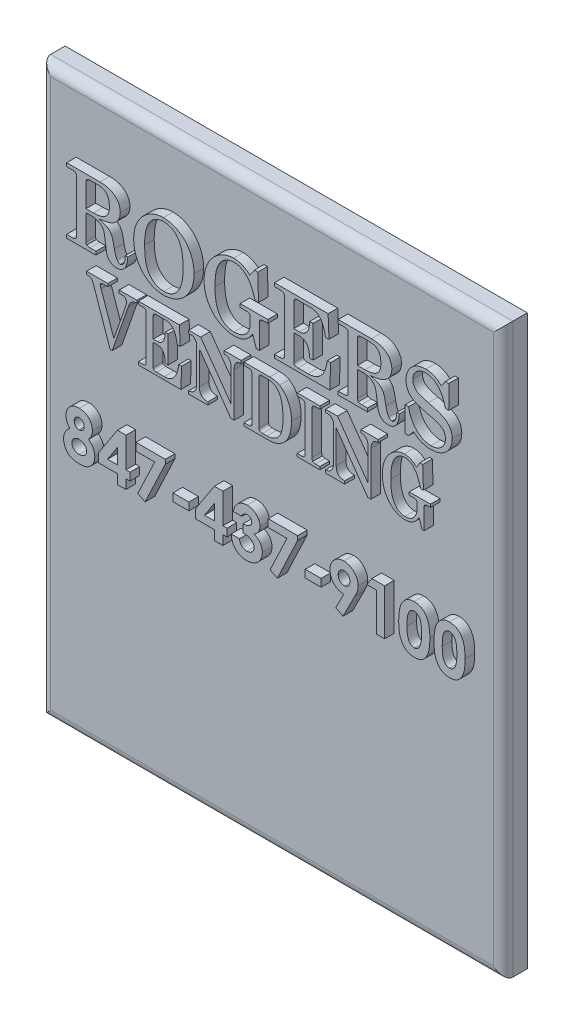
from build123d import *

# Parameters (mm, degrees)
SKETCH1_W           = 48
SKETCH1_H           = 59
BOSS_EXTRUDE1_DEPTH = 2.5
FILLET1_R           = 1
SKETCH6_W           = 1.648557692
SKETCH6_H           = 0.79375
SKETCH6_W_2         = 1.648557693
BOSS_EXTRUDE4_DEPTH = 1
BOSS_EXTRUDE6_DEPTH = 1


with BuildPart() as part:
    # Sketch1 → Boss-Extrude1 (new body)
    with BuildSketch(Plane.XY):
        with Locations((-3.780961053, 5.328467621)):
            Rectangle(SKETCH1_W, SKETCH1_H)
    extrude(amount=BOSS_EXTRUDE1_DEPTH)

    # Fillet1
    fillet1_edges = [part.edges().sort_by_distance(p)[0] for p in [
        (-3.780961053, -24.171532379, 2.5),
        (-27.780961053, 5.328467621, 2.5),
        (20.219038947, 5.328467621, 2.5),
        (-3.780961053, 34.828467621, 2.5),
    ]]
    fillet(fillet1_edges, radius=FILLET1_R)

    # Sketch6 → Boss-Extrude4 (add)
    # profile 1 of 12: a face of its own
    with BuildSketch(Plane.XY.offset(2.5)):
        with BuildLine():
            add(Edge.make_bspline(
                [(-21.855948381, 4.159518513), (-21.80600757, 4.123834454), (-21.707154241, 4.053201079), (-21.576605152, 3.926658747), (-21.464156874, 3.785499308), (-21.370990234, 3.630588605), (-21.296347933, 3.465734385), (-21.242915371, 3.292698741), (-21.208975621, 3.113007891), (-21.205268387, 2.990669348), (-21.203394295, 2.928824402)],
                knots=[0, 0, 0, 0, 1.013736912, 2.006600758, 2.994453809, 3.989973287, 4.987781207, 5.978959008, 6.978317308, 8, 8, 8, 8], degree=3))
            add(Edge.make_bspline(
                [(-21.203394295, 2.928824402), (-21.205655244, 2.861857211), (-21.210139547, 2.729036382), (-21.249786776, 2.534254657), (-21.313438812, 2.347125595), (-21.400431741, 2.169714627), (-21.509504873, 2.007535007), (-21.636639754, 1.863959824), (-21.781996645, 1.742738794), (-21.917328029, 1.660491107), (-22.033812478, 1.605855523), (-22.127814407, 1.570889847), (-22.227074265, 1.540107461), (-22.332300356, 1.515514377), (-22.443473546, 1.496315439), (-22.560435178, 1.483636497), (-22.683262245, 1.474419678), (-22.767025111, 1.473468018), (-22.809974824, 1.472980051)],
                knots=[0, 0, 0, 0, 1.313679292, 2.605514271, 3.884962679, 5.186178731, 6.472827995, 7.711026938, 8.938935107, 10.174644318, 10.808706728, 11.462743532, 12.142127587, 12.847854939, 13.582806024, 14.355735269, 15.156897313, 16, 16, 16, 16], degree=3))
            add(Edge.make_bspline(
                [(-22.809974824, 1.472980051), (-22.855776432, 1.47360133), (-22.945217941, 1.474814566), (-23.075782621, 1.48215043), (-23.198943686, 1.495674917), (-23.314959487, 1.513478859), (-23.423718405, 1.537038633), (-23.525223661, 1.566911136), (-23.619720351, 1.600924305), (-23.735389262, 1.652712273), (-23.867577852, 1.733590275), (-24.010449813, 1.852033778), (-24.135854842, 1.99310369), (-24.244882637, 2.1528402), (-24.330822455, 2.33026061), (-24.394729865, 2.51979627), (-24.43257659, 2.720933563), (-24.437132912, 2.858702719), (-24.439451987, 2.928824402)],
                knots=[0, 0, 0, 0, 0.886964665, 1.7320671, 2.531131818, 3.285397207, 4.004107883, 4.684213108, 5.332925796, 5.947568694, 7.135706876, 8.320776993, 9.52873045, 10.778999824, 12.05415135, 13.333578234, 14.642845846, 16, 16, 16, 16], degree=3))
            add(Edge.make_bspline(
                [(-24.439451987, 2.928824402), (-24.437332741, 2.989994035), (-24.433168167, 3.110199771), (-24.403336755, 3.28633919), (-24.352184949, 3.453340201), (-24.28199671, 3.612365397), (-24.191490167, 3.763432472), (-24.080130117, 3.905429869), (-23.949328494, 4.039638603), (-23.850139179, 4.118895717), (-23.799300244, 4.159518513)],
                knots=[0, 0, 0, 0, 1.01821053, 2.000906977, 2.963938143, 3.919209931, 4.888045165, 5.887808425, 6.917407893, 8, 8, 8, 8], degree=3))
            add(Edge.make_bspline(
                [(-23.799300244, 4.159518513), (-23.830817687, 4.195869272), (-23.89286604, 4.26743297), (-23.97315722, 4.382609037), (-24.040799158, 4.501355684), (-24.098230383, 4.622709218), (-24.14068501, 4.748759044), (-24.172790494, 4.877523401), (-24.190949325, 5.010314103), (-24.193787605, 5.099818983), (-24.195221218, 5.145027828)],
                knots=[0, 0, 0, 0, 1.061529281, 2.089831458, 3.092927091, 4.075998741, 5.048384512, 6.024008542, 7.00192825, 8, 8, 8, 8], degree=3))
            add(Edge.make_bspline(
                [(-24.195221218, 5.145027828), (-24.193320465, 5.206227276), (-24.189570353, 5.32697143), (-24.156355828, 5.503527892), (-24.101211651, 5.671291719), (-24.026192691, 5.829771725), (-23.930930271, 5.975514009), (-23.817737892, 6.106212257), (-23.685024292, 6.217079044), (-23.537724733, 6.312207641), (-23.37510088, 6.387872045), (-23.198695692, 6.440816328), (-23.010639287, 6.47433285), (-22.881036426, 6.477890893), (-22.814744956, 6.479710821)],
                knots=[0, 0, 0, 0, 1.022455555, 2.017265428, 2.990720743, 3.968117071, 4.939886797, 5.893155559, 6.847550415, 7.820889576, 8.817530429, 9.83499769, 10.892607882, 12, 12, 12, 12], degree=3))
            add(Edge.make_bspline(
                [(-22.814744956, 6.479710821), (-22.749408256, 6.477887914), (-22.622015371, 6.474333628), (-22.437263806, 6.441039187), (-22.264670768, 6.38691556), (-22.105663475, 6.309653543), (-21.95988728, 6.214341597), (-21.829429249, 6.099614532), (-21.716592071, 5.965661031), (-21.620538913, 5.816148438), (-21.543999305, 5.655070281), (-21.487413844, 5.486146394), (-21.454684145, 5.310704534), (-21.4499875, 5.191587789), (-21.447625064, 5.131671458)],
                knots=[0, 0, 0, 0, 1.094655142, 2.134348324, 3.136019022, 4.118575226, 5.088726318, 6.048298823, 7.020513804, 8.015920439, 9.020015034, 10.003048569, 10.995523219, 12, 12, 12, 12], degree=3))
            add(Edge.make_bspline(
                [(-21.447625064, 5.131671458), (-21.448763106, 5.089325834), (-21.450996429, 5.006225715), (-21.467509169, 4.883795787), (-21.495314596, 4.766324106), (-21.534081658, 4.650971866), (-21.587981107, 4.534604302), (-21.660919593, 4.414991601), (-21.749639684, 4.287163832), (-21.819316004, 4.203503169), (-21.855948381, 4.159518513)],
                knots=[0, 0, 0, 0, 0.940746401, 1.846144481, 2.739104268, 3.619506754, 4.545839139, 5.581956076, 6.728711598, 8, 8, 8, 8], degree=3))
        make_face()
        with BuildLine():
            add(Edge.make_bspline(
                [(-22.835733538, 5.624903128), (-22.870927755, 5.623206441), (-22.939388285, 5.61990601), (-23.037073443, 5.590115964), (-23.124895588, 5.541392226), (-23.200850006, 5.474338774), (-23.263136588, 5.392979454), (-23.308913803, 5.299440291), (-23.336060233, 5.194875662), (-23.33893421, 5.121657526), (-23.340413526, 5.083970135)],
                knots=[0, 0, 0, 0, 1.018099191, 1.980427864, 2.929421084, 3.909248076, 4.895556904, 5.880788387, 6.909183412, 8, 8, 8, 8], degree=3))
            add(Edge.make_bspline(
                [(-23.340413526, 5.083970135), (-23.338586119, 5.045960887), (-23.335017931, 4.971744165), (-23.306958142, 4.865170509), (-23.259129455, 4.768584469), (-23.193460992, 4.684003411), (-23.113663176, 4.614920049), (-23.024314083, 4.562158022), (-22.924422817, 4.532037549), (-22.855007973, 4.527953106), (-22.819515088, 4.525864667)],
                knots=[0, 0, 0, 0, 1.07118507, 2.091592095, 3.082435519, 4.092579768, 5.090825648, 6.043203473, 6.999459622, 8, 8, 8, 8], degree=3))
            add(Edge.make_bspline(
                [(-22.819515088, 4.525864667), (-22.783351192, 4.527482849), (-22.712897136, 4.530635371), (-22.612756455, 4.561537387), (-22.522542498, 4.610958862), (-22.445287574, 4.680829894), (-22.381296763, 4.765441584), (-22.334693734, 4.86371555), (-22.307870714, 4.97380535), (-22.304289746, 5.050748014), (-22.302432756, 5.090648321)],
                knots=[0, 0, 0, 0, 1.008803858, 1.965339183, 2.900766489, 3.864508618, 4.855158575, 5.849593072, 6.884859315, 8, 8, 8, 8], degree=3))
            add(Edge.make_bspline(
                [(-22.302432756, 5.090648321), (-22.30433672, 5.128310797), (-22.308018919, 5.201148704), (-22.334421695, 5.305720117), (-22.382911715, 5.397799356), (-22.446621345, 5.478653452), (-22.526496146, 5.54385725), (-22.61922494, 5.591808517), (-22.724124911, 5.619620716), (-22.797725031, 5.623104194), (-22.835733538, 5.624903128)],
                knots=[0, 0, 0, 0, 1.065910571, 2.061433587, 3.023559535, 3.990682701, 4.956464619, 5.918590567, 6.925120432, 8, 8, 8, 8], degree=3))
        make_face(mode=Mode.SUBTRACT)
        with BuildLine():
            add(Edge.make_bspline(
                [(-22.808066771, 3.671056974), (-22.834811712, 3.670612835), (-22.887525658, 3.669737441), (-22.965019489, 3.65964284), (-23.039382784, 3.644599388), (-23.110523284, 3.62384737), (-23.178081591, 3.595557148), (-23.242630374, 3.561452762), (-23.303946712, 3.52118946), (-23.361121112, 3.475498223), (-23.41279341, 3.425347737), (-23.459371285, 3.373042406), (-23.497442123, 3.317229996), (-23.529146053, 3.259765727), (-23.554620341, 3.200194229), (-23.571460771, 3.13753448), (-23.58230365, 3.072620932), (-23.58385949, 3.028404456), (-23.584644295, 3.006100544)],
                knots=[0, 0, 0, 0, 1.129580664, 2.226389355, 3.296443603, 4.333934503, 5.352185725, 6.386189251, 7.41493955, 8.447544828, 9.47401038, 10.455044306, 11.4018853, 12.322125673, 13.225630306, 14.132028716, 15.057747923, 16, 16, 16, 16], degree=3))
            add(Edge.make_bspline(
                [(-23.584644295, 3.006100544), (-23.584270243, 2.982839766), (-23.583528357, 2.936704892), (-23.572323211, 2.869367316), (-23.556189781, 2.804424849), (-23.533529862, 2.74248539), (-23.503226527, 2.683585002), (-23.467043794, 2.627151044), (-23.423719986, 2.573579243), (-23.374429815, 2.523156829), (-23.319249688, 2.477666811), (-23.259777603, 2.437589312), (-23.196799052, 2.402254939), (-23.128423462, 2.376805723), (-23.057183055, 2.353512365), (-22.981169278, 2.339380846), (-22.901212372, 2.328982481), (-22.846583668, 2.328192815), (-22.818561062, 2.327787744)],
                knots=[0, 0, 0, 0, 0.973817353, 1.931446211, 2.852767904, 3.776304432, 4.688323523, 5.623710549, 6.581246645, 7.570897993, 8.57436511, 9.572506873, 10.574556662, 11.591826551, 12.624694332, 13.712108235, 14.826391851, 16, 16, 16, 16], degree=3))
            add(Edge.make_bspline(
                [(-22.818561062, 2.327787744), (-22.790234375, 2.328301198), (-22.735034634, 2.329301759), (-22.654343712, 2.338144822), (-22.578024421, 2.352176189), (-22.50616792, 2.372244314), (-22.438502482, 2.39795238), (-22.375935782, 2.430673662), (-22.317039317, 2.46775598), (-22.263705731, 2.511079217), (-22.215008236, 2.558292502), (-22.173048507, 2.610034248), (-22.137370615, 2.664640627), (-22.108592507, 2.722701661), (-22.085371158, 2.783943277), (-22.06944277, 2.848976121), (-22.059558632, 2.917069373), (-22.058659057, 2.963452804), (-22.058201987, 2.987020015)],
                knots=[0, 0, 0, 0, 1.200705402, 2.339794563, 3.437264955, 4.487414319, 5.499029866, 6.500076882, 7.476298407, 8.444948224, 9.407950986, 10.347155707, 11.263432813, 12.167927724, 13.089546445, 14.03463663, 15.00140776, 16, 16, 16, 16], degree=3))
            add(Edge.make_bspline(
                [(-22.058201987, 2.987020015), (-22.059074721, 3.010895334), (-22.060780614, 3.057563309), (-22.070115009, 3.12647955), (-22.08762538, 3.191813224), (-22.110534061, 3.255079582), (-22.141007867, 3.314969434), (-22.178840438, 3.371356381), (-22.221903189, 3.425637195), (-22.272234032, 3.475395493), (-22.327262981, 3.520892262), (-22.385832527, 3.56142489), (-22.447762267, 3.595752287), (-22.513221601, 3.623813229), (-22.582449702, 3.644610186), (-22.654918356, 3.659642312), (-22.730508688, 3.6697397), (-22.781956922, 3.670613515), (-22.808066771, 3.671056974)],
                knots=[0, 0, 0, 0, 1.011708178, 1.977538892, 2.938094892, 3.871441737, 4.823268678, 5.775953079, 6.743660653, 7.753304209, 8.767430709, 9.76505158, 10.765940967, 11.761741361, 12.775867861, 13.822051386, 14.89469657, 16, 16, 16, 16], degree=3))
        make_face(mode=Mode.SUBTRACT)
    # profile 2 of 12: a face of its own
    with BuildSketch(Plane.XY.offset(2.5)):
        Polygon((-18.8583973, 6.479710821), (-17.967336602, 6.479710821), (-17.967336602, 3.365768513), (-17.539932756, 3.365768513), (-17.539932756, 2.572018513), (-17.967336602, 2.572018513), (-17.967336602, 1.595095436), (-18.822144295, 1.595095436), (-18.822144295, 2.572018513), (-20.837048141, 2.572018513), (-20.837048141, 3.437320496), align=None)
        Polygon((-18.822144295, 3.365768513), (-18.822144295, 4.986659438), (-19.876343514, 3.365768513), align=None, mode=Mode.SUBTRACT)
    # profile 3 of 12: a face of its own
    with BuildSketch(Plane.XY.offset(2.5)):
        Polygon((-16.929355833, 6.357595436), (-13.876471218, 6.357595436), (-13.876471218, 5.91397314), (-15.977237444, 1.472980051), (-16.734734439, 1.854590628), (-14.979325785, 5.563845436), (-16.929355833, 5.563845436), align=None)
    # profile 4 of 12: a face of its own
    with BuildSketch(Plane.XY.offset(2.5)):
        with Locations((-12.258442372, 3.335239667)):
            Rectangle(SKETCH6_W, SKETCH6_H)
    # profile 5 of 12: a face of its own
    with BuildSketch(Plane.XY.offset(2.5)):
        Polygon((-8.783878069, 6.479710821), (-7.892817372, 6.479710821), (-7.892817372, 3.365768513), (-7.465413526, 3.365768513), (-7.465413526, 2.572018513), (-7.892817372, 2.572018513), (-7.892817372, 1.595095436), (-8.747625064, 1.595095436), (-8.747625064, 2.572018513), (-10.76252891, 2.572018513), (-10.76252891, 3.437320496), align=None)
        Polygon((-8.747625064, 3.365768513), (-8.747625064, 4.986659438), (-9.801824283, 3.365768513), align=None, mode=Mode.SUBTRACT)
    # profile 6 of 12: a face of its own
    with BuildSketch(Plane.XY.offset(2.5)):
        with BuildLine():
            Line((-5.938971218, 5.197499282), (-6.79377891, 5.197499282))
            add(Edge.make_bspline(
                [(-6.79377891, 5.197499282), (-6.787743643, 5.240228069), (-6.775911901, 5.323995026), (-6.747600125, 5.445268711), (-6.713736185, 5.560305102), (-6.671458787, 5.668739901), (-6.621874277, 5.770766266), (-6.565486874, 5.866734302), (-6.501687009, 5.956232096), (-6.452783737, 6.010145923), (-6.428386783, 6.037042551)],
                knots=[0, 0, 0, 0, 1.111473889, 2.178970933, 3.205615836, 4.199322666, 5.174200091, 6.12565194, 7.064921805, 8, 8, 8, 8], degree=3))
            add(Edge.make_bspline(
                [(-6.428386783, 6.037042551), (-6.393197409, 6.072530704), (-6.323842852, 6.142474123), (-6.207943254, 6.232063916), (-6.08645907, 6.30959779), (-5.956953884, 6.371067206), (-5.821442892, 6.420819577), (-5.678848465, 6.454238357), (-5.529753295, 6.476412013), (-5.428014598, 6.478596195), (-5.376095617, 6.479710821)],
                knots=[0, 0, 0, 0, 1.01925491, 2.00884431, 2.983262333, 3.955970413, 4.92937149, 5.924503185, 6.940838805, 8, 8, 8, 8], degree=3))
            add(Edge.make_bspline(
                [(-5.376095617, 6.479710821), (-5.329936971, 6.478621105), (-5.239198375, 6.476478945), (-5.105835471, 6.459282843), (-4.978685102, 6.429122796), (-4.856403252, 6.389689211), (-4.74078829, 6.336033228), (-4.629288479, 6.273750052), (-4.52501913, 6.197357149), (-4.427736272, 6.111040856), (-4.338363412, 6.017681335), (-4.260966124, 5.917887686), (-4.194426286, 5.814325625), (-4.139606261, 5.706134749), (-4.097457112, 5.593131985), (-4.068204352, 5.475970136), (-4.049057711, 5.354907727), (-4.047150205, 5.272623238), (-4.046182756, 5.230890208)],
                knots=[0, 0, 0, 0, 1.091422571, 2.145516843, 3.172569842, 4.178562979, 5.178154469, 6.181868002, 7.194278174, 8.227918432, 9.254613415, 10.245994977, 11.209837596, 12.161663635, 13.10878368, 14.055455738, 15.013766427, 16, 16, 16, 16], degree=3))
            add(Edge.make_bspline(
                [(-4.046182756, 5.230890208), (-4.048168018, 5.179207324), (-4.052076389, 5.077459617), (-4.084147398, 4.928544287), (-4.134347247, 4.786154657), (-4.206865813, 4.652282972), (-4.297532491, 4.527293554), (-4.408777467, 4.415365176), (-4.537432198, 4.314742953), (-4.634015017, 4.260668558), (-4.68347242, 4.232978549)],
                knots=[0, 0, 0, 0, 0.992805628, 1.954529043, 2.915727527, 3.886831945, 4.871318353, 5.87440735, 6.911542536, 8, 8, 8, 8], degree=3))
            add(Edge.make_bspline(
                [(-4.68347242, 4.232978549), (-4.649525617, 4.221833099), (-4.582821674, 4.19993279), (-4.488010038, 4.156800378), (-4.397855006, 4.109663802), (-4.313909015, 4.054903526), (-4.235337121, 3.994733814), (-4.162618308, 3.928640312), (-4.095318098, 3.856767135), (-4.034535138, 3.778719008), (-3.980587887, 3.69574416), (-3.932183891, 3.609759259), (-3.892344704, 3.519460329), (-3.858595953, 3.425878646), (-3.832901575, 3.328173145), (-3.814810437, 3.226722429), (-3.804353315, 3.121757911), (-3.802758426, 3.050644515), (-3.801951987, 3.014686782)],
                knots=[0, 0, 0, 0, 1.059543567, 2.081955587, 3.086750234, 4.076226789, 5.052108497, 6.020845489, 6.989030705, 7.970690546, 8.952259656, 9.923888338, 10.895517021, 11.877585046, 12.873342345, 13.889638361, 14.932918083, 16, 16, 16, 16], degree=3))
            add(Edge.make_bspline(
                [(-3.801951987, 3.014686782), (-3.803586747, 2.961843514), (-3.806810161, 2.857647352), (-3.827303116, 2.704177069), (-3.865457307, 2.557856789), (-3.915651258, 2.417002877), (-3.982604542, 2.283433705), (-4.0613973, 2.154084043), (-4.158249432, 2.033439702), (-4.265883946, 1.918311158), (-4.385418348, 1.813641441), (-4.515013087, 1.722897507), (-4.651818485, 1.645023066), (-4.796700071, 1.581802376), (-4.94960751, 1.533115214), (-5.110199984, 1.497921889), (-5.279152259, 1.47639003), (-5.394475405, 1.474132823), (-5.453371759, 1.472980051)],
                knots=[0, 0, 0, 0, 1.005138573, 1.981928558, 2.936866704, 3.876260664, 4.820238198, 5.773547, 6.751179199, 7.756627054, 8.768222608, 9.766606018, 10.760583154, 11.757261445, 12.767156078, 13.807575856, 14.880313354, 16, 16, 16, 16], degree=3))
            add(Edge.make_bspline(
                [(-5.453371759, 1.472980051), (-5.509086759, 1.474195454), (-5.61803007, 1.476572014), (-5.777382462, 1.497142342), (-5.928831828, 1.530323949), (-6.072764667, 1.577096177), (-6.208624116, 1.637751764), (-6.337642201, 1.709978957), (-6.457244394, 1.797943655), (-6.568763299, 1.897674963), (-6.669725091, 2.009567829), (-6.759961157, 2.131030309), (-6.837481776, 2.262524275), (-6.902604861, 2.403487931), (-6.954821297, 2.554168568), (-6.996009469, 2.714259771), (-7.02478008, 2.884074307), (-7.03354223, 3.000910321), (-7.038009679, 3.060480051)],
                knots=[0, 0, 0, 0, 1.066544725, 2.085487077, 3.070979577, 4.031932826, 4.977951092, 5.916076795, 6.857635327, 7.814973522, 8.776389752, 9.738577119, 10.707772778, 11.69409279, 12.707140348, 13.757286496, 14.856535458, 16, 16, 16, 16], degree=3))
            Line((-7.038009679, 3.060480051), (-6.183201987, 3.060480051))
            add(Edge.make_bspline(
                [(-6.183201987, 3.060480051), (-6.17778516, 3.030527609), (-6.167234468, 2.972187372), (-6.146655992, 2.887723679), (-6.119839365, 2.809758473), (-6.088832673, 2.737598802), (-6.055340778, 2.670297235), (-6.01487456, 2.610339385), (-5.97039917, 2.55609715), (-5.906220858, 2.491613383), (-5.814473541, 2.425359004), (-5.690584267, 2.367780797), (-5.552769182, 2.334032894), (-5.456422693, 2.329915754), (-5.406624463, 2.327787744)],
                knots=[0, 0, 0, 0, 0.928156231, 1.807827665, 2.648129825, 3.438902246, 4.202261636, 4.936546065, 5.639352463, 6.338805438, 7.70633318, 9.064371875, 10.482673459, 12, 12, 12, 12], degree=3))
            add(Edge.make_bspline(
                [(-5.406624463, 2.327787744), (-5.380199762, 2.328240883), (-5.328439684, 2.329128483), (-5.252411837, 2.338966333), (-5.179984609, 2.35516928), (-5.111023098, 2.377188484), (-5.045088293, 2.404790934), (-4.983439943, 2.440382641), (-4.924821501, 2.481763081), (-4.869870204, 2.528285681), (-4.819094073, 2.578978661), (-4.776845345, 2.635112524), (-4.738233066, 2.692154562), (-4.709675146, 2.753836666), (-4.684652255, 2.816839679), (-4.669336968, 2.883450414), (-4.657772826, 2.952271557), (-4.657100765, 2.999369726), (-4.656759679, 3.02327302)],
                knots=[0, 0, 0, 0, 1.110435564, 2.175094844, 3.216326037, 4.226890168, 5.215276772, 6.21526065, 7.213097102, 8.228249917, 9.239874822, 10.221364777, 11.178138315, 12.128914389, 13.072518965, 14.022636769, 14.996447288, 16, 16, 16, 16], degree=3))
            add(Edge.make_bspline(
                [(-4.656759679, 3.02327302), (-4.657665197, 3.049415345), (-4.659467874, 3.101458723), (-4.674195934, 3.177405091), (-4.697454655, 3.250459375), (-4.729763859, 3.320298058), (-4.772909199, 3.386663728), (-4.82382022, 3.450887881), (-4.886507868, 3.509627765), (-4.955284612, 3.56769036), (-5.035038617, 3.618303431), (-5.12188575, 3.665011858), (-5.218108489, 3.702177347), (-5.321357951, 3.735373012), (-5.433587195, 3.75961861), (-5.55409932, 3.777223278), (-5.682699922, 3.790327224), (-5.771345988, 3.792207201), (-5.816855833, 3.793172359)],
                knots=[0, 0, 0, 0, 0.809814727, 1.612155564, 2.388397, 3.182215007, 3.988903953, 4.837162975, 5.715530372, 6.646997145, 7.623086902, 8.637258368, 9.698941581, 10.815059213, 11.996518529, 13.252603015, 14.589518788, 16, 16, 16, 16], degree=3))
            Line((-5.816855833, 3.793172359), (-5.816855833, 4.586922359))
            add(Edge.make_bspline(
                [(-5.816855833, 4.586922359), (-5.76019337, 4.591747916), (-5.654189121, 4.600775577), (-5.507049541, 4.621887076), (-5.383176981, 4.65010607), (-5.279594163, 4.684150759), (-5.193585629, 4.72787301), (-5.118449047, 4.776140443), (-5.053737869, 4.832196014), (-4.999048243, 4.894368151), (-4.955298244, 4.961135196), (-4.924334543, 5.031459392), (-4.903887733, 5.103164821), (-4.901950399, 5.152209173), (-4.900990449, 5.1765107)],
                knots=[0, 0, 0, 0, 1.70044513, 3.18119609, 4.440695891, 5.496282586, 6.431922213, 7.318171381, 8.16090191, 8.983045123, 9.787564368, 10.536848927, 11.275007137, 12, 12, 12, 12], degree=3))
            add(Edge.make_bspline(
                [(-4.900990449, 5.1765107), (-4.902646639, 5.20751681), (-4.905879171, 5.268034172), (-4.930984767, 5.354647266), (-4.974565239, 5.43185566), (-5.032998998, 5.499496886), (-5.104202565, 5.555995908), (-5.187665629, 5.597013234), (-5.281577034, 5.621112745), (-5.347648768, 5.623611053), (-5.381819776, 5.624903128)],
                knots=[0, 0, 0, 0, 1.009664648, 1.970651636, 2.907870547, 3.878035693, 4.867062054, 5.849714035, 6.887914197, 8, 8, 8, 8], degree=3))
            add(Edge.make_bspline(
                [(-5.381819776, 5.624903128), (-5.412791952, 5.623378615), (-5.474250235, 5.620353513), (-5.564120641, 5.597774958), (-5.649467585, 5.55976677), (-5.728523773, 5.507355719), (-5.800148013, 5.444412268), (-5.858930848, 5.369868816), (-5.907823624, 5.288191389), (-5.928547984, 5.227848497), (-5.938971218, 5.197499282)],
                knots=[0, 0, 0, 0, 0.98818071, 1.960853194, 2.938124878, 3.957524365, 4.978590984, 5.968022688, 6.978025184, 8, 8, 8, 8], degree=3))
        make_face()
    # profile 7 of 12: a face of its own
    with BuildSketch(Plane.XY.offset(2.5)):
        Polygon((-3.191375064, 6.357595436), (-0.138490449, 6.357595436), (-0.138490449, 5.91397314), (-2.239256675, 1.472980051), (-2.99675367, 1.854590628), (-1.241345016, 5.563845436), (-3.191375064, 5.563845436), align=None)
    # profile 8 of 12: a face of its own
    with BuildSketch(Plane.XY.offset(2.5)):
        with Locations((1.479538398, 3.335239667)):
            Rectangle(SKETCH6_W_2, SKETCH6_H)
    # profile 9 of 12: a face of its own
    with BuildSketch(Plane.XY.offset(2.5)):
        with BuildLine():
            Line((4.582032388, 1.472980051), (3.824535393, 1.854590628))
            Line((3.824535393, 1.854590628), (4.654538398, 3.487883897))
            add(Edge.make_bspline(
                [(4.654538398, 3.487883897), (4.605499915, 3.489133823), (4.509225508, 3.49158773), (4.367468955, 3.511979672), (4.231910577, 3.546790018), (4.100952585, 3.593131359), (3.976406089, 3.655256727), (3.856760863, 3.729400095), (3.743673199, 3.818482285), (3.636612879, 3.918614351), (3.538863385, 4.029292694), (3.454018892, 4.14832538), (3.380067158, 4.272692897), (3.322558232, 4.405202932), (3.276366771, 4.543385827), (3.24261696, 4.687956832), (3.223677459, 4.839550232), (3.221030253, 4.942723042), (3.219682628, 4.995245676)],
                knots=[0, 0, 0, 0, 1.014336294, 1.991387562, 2.955278539, 3.906441712, 4.859855302, 5.829322156, 6.813833455, 7.833278715, 8.858926674, 9.863225732, 10.85404919, 11.846815163, 12.845559416, 13.865450493, 14.913355531, 16, 16, 16, 16], degree=3))
            add(Edge.make_bspline(
                [(3.219682628, 4.995245676), (3.220932624, 5.046192114), (3.223395714, 5.146581016), (3.243851916, 5.293919254), (3.27751753, 5.435385488), (3.323705547, 5.570955685), (3.385193551, 5.699715672), (3.457163694, 5.82368153), (3.545143929, 5.940288542), (3.644531664, 6.050041497), (3.753306265, 6.150446073), (3.868706985, 6.238726232), (3.990209116, 6.312519962), (4.116251233, 6.374493082), (4.249111641, 6.420795542), (4.386870356, 6.455730405), (4.530553591, 6.475892813), (4.628082774, 6.478427968), (4.677435032, 6.479710821)],
                knots=[0, 0, 0, 0, 1.055538678, 2.079917126, 3.075849687, 4.065898488, 5.041806164, 6.028602842, 7.031727914, 8.062953097, 9.093756959, 10.095582084, 11.068815425, 12.035667573, 13.000833448, 13.979119574, 14.977382875, 16, 16, 16, 16], degree=3))
            add(Edge.make_bspline(
                [(4.677435032, 6.479710821), (4.729038788, 6.478648613), (4.830510592, 6.476559926), (4.979051687, 6.453512084), (5.121169794, 6.41815248), (5.257442362, 6.370126923), (5.386177625, 6.304946303), (5.508452773, 6.226826875), (5.62386108, 6.134040196), (5.731163146, 6.029260667), (5.828753176, 5.915293324), (5.915254594, 5.79599701), (5.987919458, 5.671604982), (6.047436427, 5.543227398), (6.093799845, 5.410663137), (6.125668787, 5.273724164), (6.14682623, 5.132644649), (6.149233524, 5.036982312), (6.150451859, 4.988567491)],
                knots=[0, 0, 0, 0, 1.062826075, 2.08990367, 3.089830715, 4.078784409, 5.060762809, 6.057138927, 7.064407536, 8.107320944, 9.143871033, 10.153461498, 11.140480137, 12.108246174, 13.065926856, 14.029354859, 15.002654194, 16, 16, 16, 16], degree=3))
            add(Edge.make_bspline(
                [(6.150451859, 4.988567491), (6.149787002, 4.951642657), (6.148447832, 4.877267739), (6.135280089, 4.765734488), (6.115301971, 4.653892111), (6.092113135, 4.559860412), (6.067802867, 4.480597401), (6.044146207, 4.413357435), (6.013794017, 4.338708448), (5.979902762, 4.256150086), (5.9406527, 4.166044376), (5.895230054, 4.068822057), (5.846380043, 3.963041227), (5.810372763, 3.890709737), (5.791737917, 3.853276025)],
                knots=[0, 0, 0, 0, 1.105131805, 2.225983929, 3.357782449, 4.505488967, 5.122909461, 5.839607681, 6.638776516, 7.535249922, 8.51168636, 9.581005249, 10.748097757, 12, 12, 12, 12], degree=3))
            Line((5.791737917, 3.853276025), (4.582032388, 1.472980051))
        make_face()
        with BuildLine():
            add(Edge.make_bspline(
                [(4.696515561, 4.281633897), (4.737474384, 4.284045262), (4.817498651, 4.288756522), (4.932448188, 4.325184992), (5.03532218, 4.387523998), (5.126503133, 4.470342196), (5.201852282, 4.571384187), (5.256636043, 4.686411512), (5.290381154, 4.813042082), (5.29385613, 4.901219143), (5.295644167, 4.946590328)],
                knots=[0, 0, 0, 0, 0.984774978, 1.924027336, 2.867853169, 3.859505234, 4.871392407, 5.881338128, 6.909850265, 8, 8, 8, 8], degree=3))
            add(Edge.make_bspline(
                [(5.295644167, 4.946590328), (5.293490672, 4.992905338), (5.28930161, 5.082999091), (5.255233235, 5.21266928), (5.197017234, 5.32988344), (5.117817695, 5.431774824), (5.025353265, 5.517044896), (4.921954694, 5.579332387), (4.810132713, 5.617848976), (4.732747989, 5.622535508), (4.693653482, 5.624903128)],
                knots=[0, 0, 0, 0, 1.104110315, 2.147758178, 3.172670271, 4.206310416, 5.210906102, 6.157051016, 7.068948237, 8, 8, 8, 8], degree=3))
            add(Edge.make_bspline(
                [(4.693653482, 5.624903128), (4.652332781, 5.622595004), (4.571199925, 5.61806302), (4.454822666, 5.579638926), (4.347541102, 5.518547563), (4.253854551, 5.432988173), (4.172772433, 5.332438665), (4.116231658, 5.214828856), (4.080462004, 5.086063556), (4.076516673, 4.995808236), (4.074490321, 4.949452407)],
                knots=[0, 0, 0, 0, 0.970967322, 1.90648639, 2.855811969, 3.858352357, 4.877096915, 5.878517833, 6.91039038, 8, 8, 8, 8], degree=3))
            add(Edge.make_bspline(
                [(4.074490321, 4.949452407), (4.076606971, 4.903757346), (4.080723636, 4.814885224), (4.11522547, 4.687536482), (4.171425502, 4.571900423), (4.248254954, 4.470061573), (4.342889919, 4.38683532), (4.450340636, 4.325160351), (4.570199425, 4.288657747), (4.653652238, 4.284017326), (4.696515561, 4.281633897)],
                knots=[0, 0, 0, 0, 1.075706617, 2.092137047, 3.084482865, 4.090466434, 5.0784141, 6.035155512, 6.990809768, 8, 8, 8, 8], degree=3))
        make_face(mode=Mode.SUBTRACT)
    # profile 10 of 12: a face of its own
    with BuildSketch(Plane.XY.offset(2.5)):
        Polygon((7.57672139, 6.357595436), (8.898048013, 6.357595436), (8.898048013, 1.595095436), (8.043240321, 1.595095436), (8.043240321, 5.563845436), (7.066317244, 5.563845436), align=None)
    # profile 11 of 12: a face of its own
    with BuildSketch(Plane.XY.offset(2.5)):
        with BuildLine():
            add(Edge.make_bspline(
                [(11.967151078, 6.479710821), (12.008527318, 6.479096579), (12.089884061, 6.477888815), (12.20970723, 6.464807749), (12.32513007, 6.445045907), (12.43660413, 6.417485029), (12.543327009, 6.381009189), (12.646075458, 6.337348232), (12.743626473, 6.284212054), (12.837224142, 6.224192011), (12.926832409, 6.156240815), (13.010297603, 6.078772942), (13.089143977, 5.993570932), (13.161664796, 5.899346683), (13.229466055, 5.796957265), (13.292324973, 5.686386443), (13.349760347, 5.567093045), (13.402415891, 5.438861798), (13.449500645, 5.29977057), (13.489160075, 5.148223925), (13.523174672, 4.984187255), (13.551885393, 4.807252247), (13.573586057, 4.617183712), (13.588212741, 4.414107924), (13.598250265, 4.198416381), (13.599069457, 4.050453754), (13.599490321, 3.974437383)],
                knots=[0, 0, 0, 0, 0.879237366, 1.728815576, 2.559023295, 3.367336655, 4.166867292, 4.954216142, 5.737608147, 6.525189134, 7.316157332, 8.124696809, 8.942788509, 9.781158001, 10.649253743, 11.551476218, 12.482711956, 13.461909668, 14.496590415, 15.601789533, 16.789733467, 18.056700938, 19.410929216, 20.8549011, 22.384193279, 24, 24, 24, 24], degree=3))
            add(Edge.make_bspline(
                [(13.599490321, 3.974437383), (13.599035481, 3.897469961), (13.598151736, 3.747923642), (13.588630004, 3.530259274), (13.572233132, 3.325709033), (13.55109966, 3.134294081), (13.522152585, 2.9561155), (13.488251536, 2.790711929), (13.447966093, 2.638143321), (13.399330383, 2.498753447), (13.346993564, 2.370296997), (13.289401079, 2.251236193), (13.227556758, 2.141248552), (13.162879123, 2.03867476), (13.091822309, 1.946538642), (13.017844849, 1.861707086), (12.937725635, 1.787411436), (12.854837994, 1.719822828), (12.766145417, 1.661412706), (12.672562568, 1.610328177), (12.572421025, 1.568892557), (12.467546201, 1.532854067), (12.356150481, 1.50698232), (12.240003929, 1.486453939), (12.117795273, 1.475108697), (12.034590698, 1.473701245), (11.991955765, 1.472980051)],
                knots=[0, 0, 0, 0, 1.643780988, 3.193836972, 4.651895693, 6.025988579, 7.305620092, 8.505800249, 9.631074763, 10.672816429, 11.65661981, 12.592235626, 13.49536222, 14.350718032, 15.179365177, 15.97804903, 16.751647189, 17.51006938, 18.259804725, 19.016521909, 19.783502495, 20.571750527, 21.382245291, 22.22305063, 23.089471752, 24, 24, 24, 24], degree=3))
            add(Edge.make_bspline(
                [(11.991955765, 1.472980051), (11.949321984, 1.473715156), (11.865803033, 1.475155216), (11.743263913, 1.486369583), (11.626501842, 1.507065481), (11.514224803, 1.533052692), (11.407214226, 1.568812818), (11.304956999, 1.611488163), (11.208239391, 1.66225395), (11.116793607, 1.720800161), (11.030931868, 1.787936551), (10.949319883, 1.862945019), (10.872138184, 1.945635439), (10.800560894, 2.036934013), (10.733415785, 2.135622094), (10.671403075, 2.242826652), (10.614560031, 2.3583916), (10.561108593, 2.482478024), (10.514666059, 2.617757362), (10.47333436, 2.765437641), (10.439476519, 2.926749899), (10.412245778, 3.101642312), (10.39050477, 3.289744363), (10.374331959, 3.491146843), (10.364757338, 3.705943561), (10.363882861, 3.853584044), (10.363432628, 3.92959814)],
                knots=[0, 0, 0, 0, 0.917216111, 1.796812873, 2.643793957, 3.46689424, 4.273913431, 5.068098542, 5.848489301, 6.620921603, 7.401012384, 8.190319798, 9.003608147, 9.831726257, 10.68377682, 11.569763213, 12.493818149, 13.453288342, 14.474581811, 15.568529029, 16.750744269, 18.018426408, 19.375425659, 20.823733699, 22.36466933, 24, 24, 24, 24], degree=3))
            add(Edge.make_bspline(
                [(10.363432628, 3.92959814), (10.364248183, 4.035213742), (10.365821806, 4.239000407), (10.385763918, 4.533412887), (10.415033881, 4.805546224), (10.458024522, 5.054945208), (10.511181856, 5.282533539), (10.579252589, 5.486811984), (10.656746168, 5.670607195), (10.722780652, 5.779488584), (10.75458347, 5.831926866)],
                knots=[0, 0, 0, 0, 1.288568992, 2.486310467, 3.599230591, 4.627010532, 5.572937695, 6.447898582, 7.252493626, 8, 8, 8, 8], degree=3))
            add(Edge.make_bspline(
                [(10.75458347, 5.831926866), (10.791562271, 5.883442218), (10.863863114, 5.984164883), (10.990283159, 6.116394914), (11.126105038, 6.229484511), (11.274118455, 6.320874357), (11.431982515, 6.392944396), (11.601052562, 6.443846653), (11.780704249, 6.47350468), (11.90407406, 6.477611215), (11.967151078, 6.479710821)],
                knots=[0, 0, 0, 0, 1.058512271, 2.069600068, 3.047294572, 4.004278952, 4.967380941, 5.939006123, 6.946246673, 8, 8, 8, 8], degree=3))
        make_face()
        with BuildLine():
            add(Edge.make_bspline(
                [(11.98813966, 5.624903128), (11.950735195, 5.623130231), (11.87740259, 5.619654411), (11.770993485, 5.590149606), (11.670656344, 5.544577843), (11.59433256, 5.489739352), (11.537204967, 5.437170082), (11.497289508, 5.389596602), (11.458797339, 5.336508027), (11.424799117, 5.275508743), (11.392695921, 5.208790525), (11.361321421, 5.136050514), (11.33560257, 5.055502057), (11.310334481, 4.968516905), (11.288197277, 4.872690149), (11.269651153, 4.767238511), (11.253081821, 4.65147623), (11.241524515, 4.525327481), (11.230749637, 4.388924248), (11.223025694, 4.241962676), (11.219796508, 4.084482412), (11.218770048, 3.976028091), (11.218240321, 3.920057876)],
                knots=[0, 0, 0, 0, 1.076674018, 2.110852608, 3.161083442, 4.239746716, 4.804137807, 5.395870207, 6.026861976, 6.692161227, 7.405688833, 8.16177676, 8.973626916, 9.841385931, 10.773283133, 11.807421078, 12.927755683, 14.143907515, 15.458935494, 16.872852025, 18.386167141, 20, 20, 20, 20], degree=3))
            add(Edge.make_bspline(
                [(11.218240321, 3.920057876), (11.219112187, 3.847545756), (11.220784056, 3.708498389), (11.229540523, 3.508543435), (11.247092136, 3.326568326), (11.268922797, 3.161339749), (11.299584853, 3.013929256), (11.334863534, 2.882942206), (11.378429567, 2.770048368), (11.428778513, 2.673615042), (11.484542239, 2.591579411), (11.545076216, 2.521848756), (11.608319481, 2.461465298), (11.67624606, 2.412416559), (11.7486939, 2.374827867), (11.825058197, 2.347790785), (11.905387478, 2.331240261), (11.960396142, 2.328945236), (11.98813966, 2.327787744)],
                knots=[0, 0, 0, 0, 1.771748488, 3.397459088, 4.888034009, 6.237357457, 7.467047327, 8.564189669, 9.548206622, 10.417051504, 11.216568818, 11.965764335, 12.669334354, 13.348544111, 14.005342236, 14.656555988, 15.322436492, 16, 16, 16, 16], degree=3))
            add(Edge.make_bspline(
                [(11.98813966, 2.327787744), (12.014931108, 2.328579786), (12.067385432, 2.330130505), (12.143875585, 2.346048435), (12.216210108, 2.37192753), (12.284170602, 2.408535328), (12.348000152, 2.455087744), (12.407386797, 2.511789349), (12.461882656, 2.579205326), (12.493632191, 2.629237952), (12.509992123, 2.655018813)],
                knots=[0, 0, 0, 0, 0.992283464, 1.942767638, 2.88273346, 3.832339453, 4.79467288, 5.803907806, 6.868395428, 8, 8, 8, 8], degree=3))
            add(Edge.make_bspline(
                [(12.509992123, 2.655018813), (12.529253188, 2.690247536), (12.569642079, 2.764119311), (12.616380173, 2.888775177), (12.655721695, 3.02936639), (12.689582368, 3.186330485), (12.712741003, 3.360286547), (12.732685191, 3.550131506), (12.742304768, 3.756821343), (12.743869445, 3.900016808), (12.744682628, 3.974437383)],
                knots=[0, 0, 0, 0, 0.710965849, 1.490837728, 2.352621235, 3.297892224, 4.334225155, 5.461620853, 6.680770821, 8, 8, 8, 8], degree=3))
            add(Edge.make_bspline(
                [(12.744682628, 3.974437383), (12.744368513, 4.049503965), (12.743763895, 4.193994319), (12.732670908, 4.401427221), (12.717223075, 4.590882751), (12.694627354, 4.76193793), (12.665553853, 4.915008007), (12.629720654, 5.050082975), (12.587475977, 5.167429041), (12.537378825, 5.266929194), (12.481893116, 5.351490676), (12.422993342, 5.424037867), (12.360430451, 5.485976829), (12.294309069, 5.537540649), (12.223098792, 5.576939274), (12.148159831, 5.604757963), (12.069338554, 5.621587337), (12.015571284, 5.623782946), (11.98813966, 5.624903128)],
                knots=[0, 0, 0, 0, 1.793836731, 3.452829483, 4.963243077, 6.335886805, 7.574563692, 8.684454726, 9.672768357, 10.54971625, 11.340229787, 12.085688095, 12.778991901, 13.440269426, 14.083255152, 14.715733572, 15.344777694, 16, 16, 16, 16], degree=3))
        make_face(mode=Mode.SUBTRACT)
    # profile 12 of 12: a face of its own
    with BuildSketch(Plane.XY.offset(2.5)):
        with BuildLine():
            add(Edge.make_bspline(
                [(15.630612616, 6.479710821), (15.671988856, 6.479096579), (15.7533456, 6.477888815), (15.873168768, 6.464807749), (15.988591608, 6.445045907), (16.100065669, 6.417485029), (16.206788548, 6.381009189), (16.309536997, 6.337348232), (16.407088012, 6.284212054), (16.50068568, 6.224192011), (16.590293947, 6.156240815), (16.673759142, 6.078772942), (16.752605515, 5.993570932), (16.825126334, 5.899346683), (16.892927594, 5.796957265), (16.955786511, 5.686386443), (17.013221885, 5.567093045), (17.065877429, 5.438861798), (17.112962184, 5.29977057), (17.152621614, 5.148223925), (17.186636211, 4.984187255), (17.215346931, 4.807252247), (17.237047595, 4.617183712), (17.25167428, 4.414107924), (17.261711803, 4.198416381), (17.262530996, 4.050453754), (17.262951859, 3.974437383)],
                knots=[0, 0, 0, 0, 0.879237366, 1.728815576, 2.559023295, 3.367336655, 4.166867292, 4.954216142, 5.737608147, 6.525189134, 7.316157332, 8.124696809, 8.942788509, 9.781158001, 10.649253743, 11.551476218, 12.482711956, 13.461909668, 14.496590415, 15.601789533, 16.789733467, 18.056700938, 19.410929216, 20.8549011, 22.384193279, 24, 24, 24, 24], degree=3))
            add(Edge.make_bspline(
                [(17.262951859, 3.974437383), (17.262497019, 3.897469961), (17.261613274, 3.747923642), (17.252091543, 3.530259274), (17.235694671, 3.325709033), (17.214561199, 3.134294081), (17.185614123, 2.9561155), (17.151713074, 2.790711929), (17.111427632, 2.638143321), (17.062791921, 2.498753447), (17.010455102, 2.370296997), (16.952862618, 2.251236193), (16.891018297, 2.141248552), (16.826340662, 2.03867476), (16.755283847, 1.946538642), (16.681306388, 1.861707086), (16.601187173, 1.787411436), (16.518299532, 1.719822828), (16.429606956, 1.661412706), (16.336024106, 1.610328177), (16.235882564, 1.568892557), (16.131007739, 1.532854067), (16.019612019, 1.50698232), (15.903465467, 1.486453939), (15.781256811, 1.475108697), (15.698052236, 1.473701245), (15.655417304, 1.472980051)],
                knots=[0, 0, 0, 0, 1.643780988, 3.193836972, 4.651895693, 6.025988579, 7.305620092, 8.505800249, 9.631074763, 10.672816429, 11.65661981, 12.592235626, 13.49536222, 14.350718032, 15.179365177, 15.97804903, 16.751647189, 17.51006938, 18.259804725, 19.016521909, 19.783502495, 20.571750527, 21.382245291, 22.22305063, 23.089471752, 24, 24, 24, 24], degree=3))
            add(Edge.make_bspline(
                [(15.655417304, 1.472980051), (15.612783522, 1.473715156), (15.529264571, 1.475155216), (15.406725451, 1.486369583), (15.28996338, 1.507065481), (15.177686341, 1.533052692), (15.070675765, 1.568812818), (14.968418538, 1.611488163), (14.87170093, 1.66225395), (14.780255145, 1.720800161), (14.694393406, 1.787936551), (14.612781422, 1.862945019), (14.535599722, 1.945635439), (14.464022432, 2.036934013), (14.396877324, 2.135622094), (14.334864614, 2.242826652), (14.27802157, 2.3583916), (14.224570131, 2.482478024), (14.178127597, 2.617757362), (14.136795898, 2.765437641), (14.102938057, 2.926749899), (14.075707316, 3.101642312), (14.053966308, 3.289744363), (14.037793497, 3.491146843), (14.028218877, 3.705943561), (14.0273444, 3.853584044), (14.026894167, 3.92959814)],
                knots=[0, 0, 0, 0, 0.917216111, 1.796812873, 2.643793957, 3.46689424, 4.273913431, 5.068098542, 5.848489301, 6.620921603, 7.401012384, 8.190319798, 9.003608147, 9.831726257, 10.68377682, 11.569763213, 12.493818149, 13.453288342, 14.474581811, 15.568529029, 16.750744269, 18.018426408, 19.375425659, 20.823733699, 22.36466933, 24, 24, 24, 24], degree=3))
            add(Edge.make_bspline(
                [(14.026894167, 3.92959814), (14.027709722, 4.035213742), (14.029283345, 4.239000407), (14.049225457, 4.533412887), (14.078495419, 4.805546224), (14.121486061, 5.054945208), (14.174643394, 5.282533539), (14.242714128, 5.486811984), (14.320207706, 5.670607195), (14.386242191, 5.779488584), (14.418045008, 5.831926866)],
                knots=[0, 0, 0, 0, 1.288568992, 2.486310467, 3.599230591, 4.627010532, 5.572937695, 6.447898582, 7.252493626, 8, 8, 8, 8], degree=3))
            add(Edge.make_bspline(
                [(14.418045008, 5.831926866), (14.455023809, 5.883442218), (14.527324652, 5.984164883), (14.653744698, 6.116394914), (14.789566577, 6.229484511), (14.937579993, 6.320874357), (15.095444053, 6.392944396), (15.264514101, 6.443846653), (15.444165788, 6.47350468), (15.567535598, 6.477611215), (15.630612616, 6.479710821)],
                knots=[0, 0, 0, 0, 1.058512271, 2.069600068, 3.047294572, 4.004278952, 4.967380941, 5.939006123, 6.946246673, 8, 8, 8, 8], degree=3))
        make_face()
        with BuildLine():
            add(Edge.make_bspline(
                [(15.651601198, 5.624903128), (15.614196734, 5.623130231), (15.540864128, 5.619654411), (15.434455024, 5.590149606), (15.334117882, 5.544577843), (15.257794099, 5.489739352), (15.200666505, 5.437170082), (15.160751047, 5.389596602), (15.122258878, 5.336508027), (15.088260656, 5.275508743), (15.056157459, 5.208790525), (15.02478296, 5.136050514), (14.999064108, 5.055502057), (14.973796019, 4.968516905), (14.951658815, 4.872690149), (14.933112691, 4.767238511), (14.91654336, 4.65147623), (14.904986053, 4.525327481), (14.894211176, 4.388924248), (14.886487233, 4.241962676), (14.883258046, 4.084482412), (14.882231586, 3.976028091), (14.881701859, 3.920057876)],
                knots=[0, 0, 0, 0, 1.076674018, 2.110852608, 3.161083442, 4.239746716, 4.804137807, 5.395870207, 6.026861976, 6.692161227, 7.405688833, 8.16177676, 8.973626916, 9.841385931, 10.773283133, 11.807421078, 12.927755683, 14.143907515, 15.458935494, 16.872852025, 18.386167141, 20, 20, 20, 20], degree=3))
            add(Edge.make_bspline(
                [(14.881701859, 3.920057876), (14.882573726, 3.847545756), (14.884245594, 3.708498389), (14.893002062, 3.508543435), (14.910553674, 3.326568326), (14.932384336, 3.161339749), (14.963046392, 3.013929256), (14.998325072, 2.882942206), (15.041891105, 2.770048368), (15.092240051, 2.673615042), (15.148003777, 2.591579411), (15.208537755, 2.521848756), (15.271781019, 2.461465298), (15.339707598, 2.412416559), (15.412155439, 2.374827867), (15.488519736, 2.347790785), (15.568849017, 2.331240261), (15.62385768, 2.328945236), (15.651601198, 2.327787744)],
                knots=[0, 0, 0, 0, 1.771748488, 3.397459088, 4.888034009, 6.237357457, 7.467047327, 8.564189669, 9.548206622, 10.417051504, 11.216568818, 11.965764335, 12.669334354, 13.348544111, 14.005342236, 14.656555988, 15.322436492, 16, 16, 16, 16], degree=3))
            add(Edge.make_bspline(
                [(15.651601198, 2.327787744), (15.678392646, 2.328579786), (15.730846971, 2.330130505), (15.807337123, 2.346048435), (15.879671647, 2.37192753), (15.947632141, 2.408535328), (16.01146169, 2.455087744), (16.070848336, 2.511789349), (16.125344195, 2.579205326), (16.15709373, 2.629237952), (16.173453662, 2.655018813)],
                knots=[0, 0, 0, 0, 0.992283464, 1.942767638, 2.88273346, 3.832339453, 4.79467288, 5.803907806, 6.868395428, 8, 8, 8, 8], degree=3))
            add(Edge.make_bspline(
                [(16.173453662, 2.655018813), (16.192714727, 2.690247536), (16.233103617, 2.764119311), (16.279841711, 2.888775177), (16.319183233, 3.02936639), (16.353043907, 3.186330485), (16.376202541, 3.360286547), (16.396146729, 3.550131506), (16.405766307, 3.756821343), (16.407330984, 3.900016808), (16.408144167, 3.974437383)],
                knots=[0, 0, 0, 0, 0.710965849, 1.490837728, 2.352621235, 3.297892224, 4.334225155, 5.461620853, 6.680770821, 8, 8, 8, 8], degree=3))
            add(Edge.make_bspline(
                [(16.408144167, 3.974437383), (16.407830052, 4.049503965), (16.407225434, 4.193994319), (16.396132446, 4.401427221), (16.380684613, 4.590882751), (16.358088893, 4.76193793), (16.329015392, 4.915008007), (16.293182192, 5.050082975), (16.250937515, 5.167429041), (16.200840363, 5.266929194), (16.145354654, 5.351490676), (16.086454881, 5.424037867), (16.02389199, 5.485976829), (15.957770607, 5.537540649), (15.886560331, 5.576939274), (15.811621369, 5.604757963), (15.732800092, 5.621587337), (15.679032823, 5.623782946), (15.651601198, 5.624903128)],
                knots=[0, 0, 0, 0, 1.793836731, 3.452829483, 4.963243077, 6.335886805, 7.574563692, 8.684454726, 9.672768357, 10.54971625, 11.340229787, 12.085688095, 12.778991901, 13.440269426, 14.083255152, 14.715733572, 15.344777694, 16, 16, 16, 16], degree=3))
        make_face(mode=Mode.SUBTRACT)
    extrude(amount=BOSS_EXTRUDE4_DEPTH)

    # Sketch8 → Boss-Extrude6 (add)
    # profile 1 of 13: a face of its own
    with BuildSketch(Plane.XY.offset(2.5)):
        with BuildLine():
            Line((-24.126194302, 27.90761574), (-20.668832841, 27.90761574))
            add(Edge.make_bspline(
                [(-20.668832841, 27.90761574), (-20.587173821, 27.906502995), (-20.428532915, 27.904341238), (-20.197637526, 27.882091589), (-19.981022494, 27.846196453), (-19.77875429, 27.794071008), (-19.589912065, 27.72923852), (-19.415101155, 27.649103574), (-19.254535164, 27.553329664), (-19.109535723, 27.44282615), (-18.978433209, 27.322359534), (-18.865190927, 27.191141808), (-18.768624644, 27.051496807), (-18.69099601, 26.901786576), (-18.629086883, 26.743279339), (-18.586073214, 26.575219259), (-18.559328168, 26.398320186), (-18.556625611, 26.27741317), (-18.555245228, 26.215657574)],
                knots=[0, 0, 0, 0, 1.283879857, 2.49422373, 3.644109154, 4.733564, 5.775312755, 6.780226247, 7.752329523, 8.709173768, 9.642539369, 10.547364715, 11.429401853, 12.306410462, 13.193533583, 14.099706314, 15.029388263, 16, 16, 16, 16], degree=3))
            add(Edge.make_bspline(
                [(-18.555245228, 26.215657574), (-18.557479946, 26.141967997), (-18.561866802, 25.997311884), (-18.60770953, 25.787330201), (-18.678179702, 25.589054494), (-18.77815646, 25.404941339), (-18.904700631, 25.236029205), (-19.056582878, 25.084181001), (-19.234759766, 24.951586411), (-19.401952449, 24.856091664), (-19.553001845, 24.790302859), (-19.68243051, 24.742015632), (-19.82846008, 24.701270418), (-19.989022258, 24.661787002), (-20.164501156, 24.625014854), (-20.355087253, 24.592748403), (-20.560990338, 24.563987199), (-20.703689465, 24.549097126), (-20.77764044, 24.541380643)],
                knots=[0, 0, 0, 0, 1.137224841, 2.232425953, 3.305140778, 4.380461003, 5.456671101, 6.556546416, 7.687407718, 8.879760467, 9.522878125, 10.232239294, 11.012772474, 11.864150045, 12.787583039, 13.782812018, 14.85098657, 16, 16, 16, 16], degree=3))
            add(Edge.make_bspline(
                [(-20.77764044, 24.541380643), (-20.72451494, 24.526697536), (-20.622037825, 24.498374368), (-20.475822461, 24.453132767), (-20.341448353, 24.410407958), (-20.221219666, 24.365188069), (-20.112969494, 24.321910125), (-20.01782605, 24.27887992), (-19.935573994, 24.235298276), (-19.843689657, 24.17796714), (-19.743869874, 24.098368048), (-19.634972078, 23.99410214), (-19.54141708, 23.874191401), (-19.471477502, 23.76376212), (-19.421000768, 23.66168925), (-19.385007258, 23.566051479), (-19.34689335, 23.454272424), (-19.31053903, 23.323779257), (-19.274337099, 23.176260061), (-19.237407397, 23.010781365), (-19.201096462, 22.827955248), (-19.17796719, 22.699849388), (-19.165927878, 22.633167374)],
                knots=[0, 0, 0, 0, 1.206438829, 2.327175689, 3.350287853, 4.292307306, 5.138200021, 5.902044599, 6.576893256, 7.174411928, 8.270266093, 9.365086199, 10.467079651, 11.590581327, 12.220829487, 12.956161795, 13.825482602, 14.805624267, 15.920059975, 17.150426224, 18.516732029, 20, 20, 20, 20], degree=3))
            add(Edge.make_bspline(
                [(-19.165927878, 22.633167374), (-19.157370078, 22.585002336), (-19.140749021, 22.491455657), (-19.10820254, 22.357237967), (-19.0775423, 22.232090976), (-19.038885122, 22.118635638), (-19.003074367, 22.013868544), (-18.959325435, 21.921358751), (-18.917074463, 21.836903701), (-18.883110934, 21.786871499), (-18.866706981, 21.762706581)],
                knots=[0, 0, 0, 0, 1.265772579, 2.458397796, 3.57407367, 4.598249002, 5.559666784, 6.436597769, 7.244896572, 8, 8, 8, 8], degree=3))
            add(Edge.make_bspline(
                [(-18.866706981, 21.762706581), (-18.842367076, 21.731367583), (-18.797255915, 21.673284422), (-18.718314776, 21.605302346), (-18.634485492, 21.561918594), (-18.575636403, 21.556083135), (-18.547084658, 21.553251953)],
                knots=[0, 0, 0, 0, 1.199130811, 2.222448485, 3.137587403, 4, 4, 4, 4], degree=3))
            add(Edge.make_bspline(
                [(-18.547084658, 21.553251953), (-18.517580537, 21.556427527), (-18.456988144, 21.56294918), (-18.370224254, 21.609899522), (-18.290168516, 21.685043169), (-18.227160862, 21.767039561), (-18.180350578, 21.848382889), (-18.147424926, 21.923077777), (-18.119380182, 22.008832228), (-18.095483016, 22.105834502), (-18.073490127, 22.213275685), (-18.056131382, 22.331801783), (-18.042872112, 22.461176713), (-18.036354932, 22.551088679), (-18.032968753, 22.597804904)],
                knots=[0, 0, 0, 0, 0.841138524, 1.72743991, 2.754725145, 3.964622261, 4.666710373, 5.432135723, 6.292307162, 7.241054536, 8.285106602, 9.424516758, 10.661837121, 12, 12, 12, 12], degree=3))
            Line((-18.032968753, 22.597804904), (-17.771830515, 22.597804904))
            add(Edge.make_bspline(
                [(-17.771830515, 22.597804904), (-17.776132179, 22.534722548), (-17.784509183, 22.411876812), (-17.808009057, 22.234459513), (-17.83752987, 22.068580902), (-17.874993518, 21.915229906), (-17.921567906, 21.773876106), (-17.975382124, 21.644974339), (-18.037185641, 21.527931035), (-18.105785335, 21.422655796), (-18.184671542, 21.3307144), (-18.269744143, 21.249925915), (-18.36404901, 21.182796158), (-18.464702205, 21.125940596), (-18.575142344, 21.084559025), (-18.691980318, 21.052561233), (-18.817244167, 21.035380957), (-18.902930092, 21.032470678), (-18.946952585, 21.030975477)],
                knots=[0, 0, 0, 0, 1.379193329, 2.685822633, 3.902295341, 5.05381776, 6.126696511, 7.14627144, 8.097589069, 9.011132489, 9.881232234, 10.734986358, 11.564030858, 12.400827998, 13.249467195, 14.130017788, 15.039267208, 16, 16, 16, 16], degree=3))
            add(Edge.make_bspline(
                [(-18.946952585, 21.030975477), (-19.001953861, 21.033080964), (-19.109258959, 21.037188679), (-19.264942811, 21.068839065), (-19.409078729, 21.122688986), (-19.542565764, 21.195632693), (-19.660248341, 21.29259411), (-19.763468032, 21.408542597), (-19.852008716, 21.544461616), (-19.894702571, 21.646306947), (-19.916700312, 21.698782116)],
                knots=[0, 0, 0, 0, 1.047310067, 2.043256379, 3.010632594, 3.969450702, 4.927140125, 5.899707092, 6.917837227, 8, 8, 8, 8], degree=3))
            add(Edge.make_bspline(
                [(-19.916700312, 21.698782116), (-19.925159651, 21.723626027), (-19.944645421, 21.780853044), (-19.969647842, 21.880452067), (-19.994913744, 22.004942752), (-20.022374702, 22.154483517), (-20.048463054, 22.329304765), (-20.077775644, 22.528628371), (-20.10564508, 22.753214153), (-20.124420897, 22.911524915), (-20.13431551, 22.994952641)],
                knots=[0, 0, 0, 0, 0.478390711, 1.10195509, 1.870434605, 2.794664839, 3.873792197, 5.093131774, 6.468118011, 8, 8, 8, 8], degree=3))
            add(Edge.make_bspline(
                [(-20.13431551, 22.994952641), (-20.139707837, 23.043986175), (-20.150071384, 23.138224033), (-20.173115458, 23.273509257), (-20.195061952, 23.398099101), (-20.221402392, 23.511885392), (-20.249005227, 23.614787755), (-20.280954981, 23.706123867), (-20.312529017, 23.787487899), (-20.36194627, 23.879451683), (-20.434316694, 23.983540685), (-20.540773245, 24.094411512), (-20.670318682, 24.189559352), (-20.816884612, 24.274456219), (-20.983037193, 24.341884475), (-21.165317967, 24.390368319), (-21.362797263, 24.42122435), (-21.49973052, 24.424221784), (-21.570575818, 24.425772569)],
                knots=[0, 0, 0, 0, 1.028548164, 1.976773217, 2.861390999, 3.666484284, 4.412018593, 5.081814562, 5.684068578, 6.229699931, 7.255288488, 8.31854149, 9.419144819, 10.596629043, 11.843300618, 13.146114873, 14.523482561, 16, 16, 16, 16], degree=3))
            Line((-21.570575818, 24.425772569), (-22.124134479, 24.425772569))
            Line((-22.124134479, 24.425772569), (-22.124134479, 21.788548386))
            add(Edge.make_bspline(
                [(-22.124134479, 21.788548386), (-22.123317333, 21.762567898), (-22.121792626, 21.714091093), (-22.105007149, 21.647927241), (-22.080234538, 21.591690053), (-22.052955866, 21.564834977), (-22.03980859, 21.551891858)],
                knots=[0, 0, 0, 0, 1.200674003, 2.240328943, 3.151905871, 4, 4, 4, 4], degree=3))
            add(Edge.make_bspline(
                [(-22.03980859, 21.551891858), (-22.019941684, 21.538144851), (-21.978262659, 21.50930484), (-21.899691168, 21.485220183), (-21.808876483, 21.468665756), (-21.742957059, 21.467059174), (-21.707945412, 21.466205873)],
                knots=[0, 0, 0, 0, 0.826964289, 1.734898464, 2.796941306, 4, 4, 4, 4], degree=3))
            Line((-21.707945412, 21.466205873), (-21.079581528, 21.466205873))
            Line((-21.079581528, 21.466205873), (-21.079581528, 21.118021556))
            Line((-21.079581528, 21.118021556), (-24.126194302, 21.118021556))
            Line((-24.126194302, 21.118021556), (-24.126194302, 21.466205873))
            Line((-24.126194302, 21.466205873), (-23.489669848, 21.466205873))
            add(Edge.make_bspline(
                [(-23.489669848, 21.466205873), (-23.456943103, 21.467087741), (-23.395556191, 21.468741897), (-23.310143108, 21.484960775), (-23.237790842, 21.511200763), (-23.179997814, 21.550675596), (-23.135552035, 21.599258189), (-23.103505021, 21.655924761), (-23.085644965, 21.72131888), (-23.083022893, 21.767130773), (-23.081641351, 21.791268576)],
                knots=[0, 0, 0, 0, 1.322849184, 2.481323038, 3.503366862, 4.414154492, 5.284122715, 6.146514873, 7.023418293, 8, 8, 8, 8], degree=3))
            Line((-23.081641351, 21.791268576), (-23.081641351, 27.211247106))
            add(Edge.make_bspline(
                [(-23.081641351, 27.211247106), (-23.08309535, 27.238508502), (-23.085843776, 27.290039457), (-23.102352435, 27.363345435), (-23.136402171, 27.424005978), (-23.180958013, 27.475478674), (-23.240104636, 27.513601964), (-23.311754092, 27.541085073), (-23.396519554, 27.556710805), (-23.457416005, 27.558489393), (-23.489669848, 27.559431423)],
                knots=[0, 0, 0, 0, 1.066531836, 2.016015794, 2.903845426, 3.757070895, 4.651239732, 5.621644264, 6.74030242, 8, 8, 8, 8], degree=3))
            Line((-23.489669848, 27.559431423), (-24.126194302, 27.559431423))
            Line((-24.126194302, 27.559431423), (-24.126194302, 27.90761574))
        make_face()
        with BuildLine():
            Line((-22.124134479, 24.773956886), (-21.348880335, 24.773956886))
            add(Edge.make_bspline(
                [(-21.348880335, 24.773956886), (-21.285394227, 24.775210487), (-21.162354732, 24.777640033), (-20.982765707, 24.790411799), (-20.814086933, 24.815890766), (-20.654845985, 24.846740488), (-20.507594946, 24.891426701), (-20.369877749, 24.942285287), (-20.244019078, 25.005598406), (-20.126157622, 25.075393109), (-20.022252768, 25.160623229), (-19.930367355, 25.259348297), (-19.856128558, 25.375901738), (-19.792872147, 25.505164224), (-19.746186204, 25.650146803), (-19.710223505, 25.80883468), (-19.690583122, 25.983043633), (-19.688118899, 26.104084692), (-19.686844259, 26.166694154)],
                knots=[0, 0, 0, 0, 1.219595185, 2.363641091, 3.454730401, 4.494761589, 5.475621669, 6.407157146, 7.310634959, 8.178322238, 9.032401173, 9.882921431, 10.757225062, 11.676345793, 12.640127146, 13.675298604, 14.79752949, 16, 16, 16, 16], degree=3))
            add(Edge.make_bspline(
                [(-19.686844259, 26.166694154), (-19.689037644, 26.251542952), (-19.693204947, 26.412750648), (-19.72126443, 26.641390879), (-19.774291048, 26.841507934), (-19.846102218, 27.014656209), (-19.937110099, 27.159642982), (-20.039012309, 27.282184795), (-20.156962506, 27.377882285), (-20.268102072, 27.437867834), (-20.369311579, 27.47371107), (-20.461917732, 27.496220451), (-20.570381986, 27.516490212), (-20.695734568, 27.532422989), (-20.83690659, 27.543925258), (-20.994229374, 27.55380917), (-21.167952369, 27.558995341), (-21.28948661, 27.559281809), (-21.35296062, 27.559431423)],
                knots=[0, 0, 0, 0, 1.583904885, 3.009325589, 4.288147178, 5.437094785, 6.493769576, 7.47222241, 8.398684323, 9.311127006, 9.814333876, 10.39927682, 11.088061335, 11.873191318, 12.756563886, 13.731534083, 14.815242278, 16, 16, 16, 16], degree=3))
            add(Edge.make_bspline(
                [(-21.35296062, 27.559431423), (-21.394666645, 27.559002362), (-21.473554288, 27.558190786), (-21.585664537, 27.556667433), (-21.684884387, 27.548927167), (-21.772151586, 27.541807525), (-21.846874209, 27.530354789), (-21.910123561, 27.519485805), (-21.960229912, 27.503338527), (-22.010004493, 27.480203631), (-22.057455878, 27.440953078), (-22.096282557, 27.379809844), (-22.120227817, 27.305882062), (-22.122770647, 27.252252087), (-22.124134479, 27.223487961)],
                knots=[0, 0, 0, 0, 1.568367801, 2.966593976, 4.213901723, 5.309659579, 6.257081416, 7.056086357, 7.719147992, 8.229973534, 9.113927885, 9.988629374, 10.921213019, 12, 12, 12, 12], degree=3))
            Line((-22.124134479, 27.223487961), (-22.124134479, 24.773956886))
        make_face(mode=Mode.SUBTRACT)
    # profile 2 of 13: a face of its own
    with BuildSketch(Plane.XY.offset(2.5)):
        with BuildLine():
            add(Edge.make_bspline(
                [(-14.088693285, 27.994661819), (-14.017925512, 27.993338842), (-13.877453918, 27.990712778), (-13.668267109, 27.970113836), (-13.46319904, 27.934005944), (-13.260569602, 27.887107866), (-13.061903034, 27.8236109), (-12.865515479, 27.748122402), (-12.674139917, 27.655952876), (-12.485876394, 27.553133452), (-12.305368784, 27.436747317), (-12.132461481, 27.309959181), (-11.971246636, 27.171093638), (-11.818981054, 27.022083587), (-11.677603686, 26.861604964), (-11.546963965, 26.689338298), (-11.425425894, 26.507116992), (-11.316103878, 26.313895713), (-11.216261258, 26.113260792), (-11.131063645, 25.904271904), (-11.056866167, 25.68988298), (-10.99890849, 25.468183854), (-10.952856472, 25.241123393), (-10.918052244, 25.007893823), (-10.899472442, 24.767917008), (-10.896629607, 24.605787282), (-10.895190252, 24.523699408)],
                knots=[0, 0, 0, 0, 0.967824839, 1.921099005, 2.871201609, 3.814236228, 4.763427831, 5.721489822, 6.689493423, 7.666393394, 8.653707453, 9.624784561, 10.596653254, 11.56131451, 12.536638835, 13.518877097, 14.516361632, 15.530058408, 16.553344216, 17.579350611, 18.614720649, 19.654038215, 20.710818977, 21.782431397, 22.877223212, 24, 24, 24, 24], degree=3))
            add(Edge.make_bspline(
                [(-10.895190252, 24.523699408), (-10.896429987, 24.441592976), (-10.898879119, 24.279389366), (-10.920340814, 24.039707482), (-10.952375284, 23.806164729), (-10.998776331, 23.57857668), (-11.058709765, 23.356446248), (-11.131916522, 23.140035112), (-11.219455215, 22.930473774), (-11.318416143, 22.727611963), (-11.429794305, 22.533930961), (-11.550872443, 22.349818439), (-11.681723871, 22.176723093), (-11.822077026, 22.014029998), (-11.973491395, 21.862702494), (-12.135069276, 21.722985012), (-12.306596549, 21.594253245), (-12.485894453, 21.476750925), (-12.672375308, 21.372145614), (-12.862151188, 21.280918466), (-13.055610107, 21.204598268), (-13.250618942, 21.140386905), (-13.449202687, 21.09066036), (-13.650845328, 21.057939889), (-13.855110707, 21.034361097), (-13.992511667, 21.032107071), (-14.061491385, 21.030975477)],
                knots=[0, 0, 0, 0, 1.125510685, 2.223478632, 3.296818789, 4.356172752, 5.405632843, 6.449407763, 7.486032375, 8.517388164, 9.542034991, 10.547132123, 11.53671359, 12.515005379, 13.490766212, 14.469058001, 15.441228659, 16.429110232, 17.405979166, 18.370729174, 19.313768414, 20.255331527, 21.184003265, 22.11699192, 23.054669145, 24, 24, 24, 24], degree=3))
            add(Edge.make_bspline(
                [(-14.061491385, 21.030975477), (-14.128642376, 21.032267556), (-14.262347638, 21.034840233), (-14.460941588, 21.055980639), (-14.657009181, 21.089640645), (-14.849359354, 21.139248533), (-15.03912316, 21.200113546), (-15.225502275, 21.275582022), (-15.408165498, 21.365516078), (-15.588112359, 21.467289131), (-15.761743664, 21.582161278), (-15.926176541, 21.711069871), (-16.084176045, 21.849299749), (-16.229521399, 22.003267092), (-16.371752233, 22.16407784), (-16.499723025, 22.34094978), (-16.621459113, 22.527659325), (-16.733855109, 22.724921079), (-16.834111473, 22.931861349), (-16.922894731, 23.144485098), (-16.996060261, 23.36388967), (-17.057894817, 23.587455229), (-17.103561798, 23.817639444), (-17.137656711, 24.052290792), (-17.158719553, 24.293005601), (-17.161234772, 24.455199063), (-17.16250796, 24.537300358)],
                knots=[0, 0, 0, 0, 0.928119981, 1.847992489, 2.757839131, 3.675980525, 4.591679992, 5.511125367, 6.452941866, 7.40446807, 8.367484075, 9.327804153, 10.291227974, 11.266384124, 12.252794682, 13.256887369, 14.28081437, 15.333400786, 16.392961436, 17.457957947, 18.51633158, 19.588239906, 20.662527609, 21.758068888, 22.865148787, 24, 24, 24, 24], degree=3))
            add(Edge.make_bspline(
                [(-17.16250796, 24.537300358), (-17.161107989, 24.618035124), (-17.158335625, 24.777914217), (-17.1390499, 25.015007274), (-17.106794639, 25.246270724), (-17.060100048, 25.470931972), (-17.001933676, 25.689666226), (-16.92920689, 25.901934407), (-16.845388623, 26.109075131), (-16.747481019, 26.30896499), (-16.636791381, 26.499609637), (-16.51971885, 26.682911526), (-16.389122186, 26.853130022), (-16.250679405, 27.013508835), (-16.103415542, 27.164370021), (-15.945205423, 27.302903142), (-15.777616031, 27.431167325), (-15.601380687, 27.547323861), (-15.419743574, 27.651914764), (-15.234746984, 27.743027508), (-15.04806983, 27.82080846), (-14.860186306, 27.885184672), (-14.670193985, 27.934817097), (-14.478061327, 27.967597777), (-14.284225592, 27.991288459), (-14.154050377, 27.993534266), (-14.088693285, 27.994661819)],
                knots=[0, 0, 0, 0, 1.13066055, 2.239047609, 3.329169951, 4.398852261, 5.450824381, 6.496954942, 7.539282538, 8.578608171, 9.611103551, 10.625537657, 11.622432682, 12.612795142, 13.591610418, 14.572400772, 15.555346826, 16.545057732, 17.526361778, 18.489000264, 19.431171628, 20.356830755, 21.268534423, 22.177780515, 23.085117963, 24, 24, 24, 24], degree=3))
        make_face()
        with BuildLine():
            add(Edge.make_bspline(
                [(-14.015248156, 27.646477502), (-14.088399982, 27.644710972), (-14.232425901, 27.641232916), (-14.442641075, 27.604098915), (-14.642266481, 27.547590444), (-14.831633588, 27.467570581), (-15.009527589, 27.363922712), (-15.17721237, 27.237549569), (-15.332610072, 27.087340373), (-15.47944248, 26.915925092), (-15.610622521, 26.717098735), (-15.723475872, 26.489827037), (-15.820033802, 26.234830178), (-15.895934017, 25.950155118), (-15.957401329, 25.637600504), (-15.999014623, 25.29621557), (-16.027538175, 24.926318018), (-16.029757415, 24.670196272), (-16.030908929, 24.537300358)],
                knots=[0, 0, 0, 0, 0.839890496, 1.653629273, 2.445180831, 3.220323151, 4.009418736, 4.805552694, 5.627341666, 6.488615774, 7.394680828, 8.357018814, 9.399205646, 10.522900733, 11.738874056, 13.057240376, 14.473067053, 16, 16, 16, 16], degree=3))
            add(Edge.make_bspline(
                [(-16.030908929, 24.537300358), (-16.02895261, 24.394002522), (-16.025191352, 24.11849516), (-16.000347053, 23.722469324), (-15.955896219, 23.360904231), (-15.89429926, 23.033439803), (-15.815063219, 22.740038487), (-15.717975629, 22.480331047), (-15.601132108, 22.25541309), (-15.46642387, 22.063688539), (-15.317249613, 21.902227179), (-15.160128408, 21.762841646), (-14.995639953, 21.643087303), (-14.821017944, 21.547552961), (-14.638693591, 21.471971297), (-14.447704401, 21.417074662), (-14.247508129, 21.385634585), (-14.111469289, 21.381339104), (-14.042450056, 21.379159794)],
                knots=[0, 0, 0, 0, 1.63304, 3.139716252, 4.519435137, 5.781985075, 6.933866084, 7.978806216, 8.935558743, 9.814257261, 10.640716391, 11.434909074, 12.204885608, 12.954111057, 13.697703892, 14.449969385, 15.213592797, 16, 16, 16, 16], degree=3))
            add(Edge.make_bspline(
                [(-14.042450056, 21.379159794), (-13.993915064, 21.38041506), (-13.898472561, 21.3828835), (-13.75695752, 21.396185379), (-13.620189861, 21.420849536), (-13.487757073, 21.454603677), (-13.360280472, 21.499008826), (-13.236267805, 21.551061128), (-13.118189563, 21.616301812), (-13.002999265, 21.687774445), (-12.893500722, 21.771330364), (-12.790324488, 21.867056259), (-12.691776741, 21.973659901), (-12.599495095, 22.091980486), (-12.5139272, 22.222034574), (-12.433240111, 22.362710201), (-12.358973175, 22.515192151), (-12.289335847, 22.678819614), (-12.225966015, 22.854582735), (-12.174473265, 23.044213681), (-12.126828578, 23.246181733), (-12.091951451, 23.462277153), (-12.06098211, 23.690699774), (-12.041509598, 23.932689248), (-12.028968745, 24.187620124), (-12.027526759, 24.362285192), (-12.026789282, 24.451614374)],
                knots=[0, 0, 0, 0, 0.844215468, 1.660122611, 2.468990003, 3.258764898, 4.034202523, 4.814793676, 5.594428613, 6.37752428, 7.170715664, 7.98536472, 8.822295798, 9.692901611, 10.591649135, 11.527532596, 12.511309529, 13.539334135, 14.619145676, 15.757391254, 16.954671803, 18.226230615, 19.562111528, 20.96264498, 22.446601599, 24, 24, 24, 24], degree=3))
            add(Edge.make_bspline(
                [(-12.026789282, 24.451614374), (-12.027703913, 24.548640262), (-12.029482479, 24.737314125), (-12.039443148, 25.01229644), (-12.060503604, 25.271225986), (-12.087196113, 25.513499791), (-12.120329347, 25.739829832), (-12.16440527, 25.94881953), (-12.213732737, 26.142663844), (-12.272825409, 26.320450786), (-12.338406253, 26.484785641), (-12.410394699, 26.637554373), (-12.489380115, 26.779374213), (-12.574605049, 26.910378074), (-12.668174687, 27.029374343), (-12.766715038, 27.138175476), (-12.872786917, 27.236013942), (-12.985107113, 27.322426386), (-13.102520249, 27.398323192), (-13.222354825, 27.465895662), (-13.346292296, 27.521503578), (-13.473753703, 27.566638115), (-13.604308321, 27.601780096), (-13.738272103, 27.628157826), (-13.875729497, 27.64299637), (-13.968518225, 27.645311543), (-14.015248156, 27.646477502)],
                knots=[0, 0, 0, 0, 1.648508739, 3.205644585, 4.67368368, 6.061020544, 7.34644752, 8.557978873, 9.688261573, 10.742949233, 11.738457912, 12.692860119, 13.610078871, 14.494532111, 15.345063012, 16.179253634, 16.986002055, 17.793301847, 18.583780662, 19.35960042, 20.128391045, 20.888489229, 21.654574062, 22.423480436, 23.2060388, 24, 24, 24, 24], degree=3))
        make_face(mode=Mode.SUBTRACT)
    # profile 3 of 13: a face of its own
    with BuildSketch(Plane.XY.offset(2.5)):
        with BuildLine():
            Line((-5.091664934, 27.328215275), (-4.627872543, 27.994661819))
            Line((-4.627872543, 27.994661819), (-4.279688226, 27.994661819))
            Line((-4.279688226, 27.994661819), (-4.192642147, 25.296233362))
            Line((-4.192642147, 25.296233362), (-4.540826464, 25.296233362))
            add(Edge.make_bspline(
                [(-4.540826464, 25.296233362), (-4.569137654, 25.390304692), (-4.624020399, 25.572666959), (-4.715310407, 25.833986828), (-4.810397067, 26.075478396), (-4.909219098, 26.296534609), (-5.01089997, 26.498485219), (-5.119070458, 26.678796714), (-5.22713038, 26.842289208), (-5.308365244, 26.938111071), (-5.347362792, 26.984111243)],
                knots=[0, 0, 0, 0, 1.251020926, 2.425170469, 3.524171439, 4.555392157, 5.508244528, 6.40142918, 7.232591291, 8, 8, 8, 8], degree=3))
            add(Edge.make_bspline(
                [(-5.347362792, 26.984111243), (-5.396811648, 27.036681836), (-5.49318385, 27.139138076), (-5.649472395, 27.274865532), (-5.811257094, 27.390043218), (-5.980171188, 27.482737314), (-6.152861053, 27.557162564), (-6.331807062, 27.609516578), (-6.516474277, 27.639613759), (-6.641613014, 27.644176093), (-6.704737591, 27.646477502)],
                knots=[0, 0, 0, 0, 1.110969946, 2.165199143, 3.18223948, 4.163564161, 5.127141723, 6.07281956, 7.027859374, 8, 8, 8, 8], degree=3))
            add(Edge.make_bspline(
                [(-6.704737591, 27.646477502), (-6.75328619, 27.645358284), (-6.848801434, 27.643156316), (-6.990248249, 27.627885557), (-7.12771865, 27.60239542), (-7.261497831, 27.564788524), (-7.392175772, 27.519581662), (-7.517859564, 27.461054762), (-7.640800042, 27.39496522), (-7.758699003, 27.317097346), (-7.872244939, 27.230266366), (-7.978617074, 27.131781314), (-8.077742857, 27.022643275), (-8.170452515, 26.903959066), (-8.256727876, 26.774825266), (-8.336685135, 26.635519967), (-8.408440811, 26.485131375), (-8.474446549, 26.324612783), (-8.533595647, 26.150453167), (-8.583154763, 25.959885615), (-8.62532484, 25.752392701), (-8.658515559, 25.528003929), (-8.685413548, 25.287103647), (-8.706420107, 25.029527253), (-8.716339769, 24.754994988), (-8.718121837, 24.56632137), (-8.719038269, 24.469295608)],
                knots=[0, 0, 0, 0, 0.823796013, 1.620748659, 2.411437733, 3.193508172, 3.977053112, 4.755139854, 5.543542341, 6.343756339, 7.150123229, 7.966811042, 8.800037687, 9.649585728, 10.520193315, 11.433440101, 12.372853853, 13.345819764, 14.377400787, 15.491493967, 16.685002667, 17.968944224, 19.339386818, 20.798059807, 22.353396251, 24, 24, 24, 24], degree=3))
            add(Edge.make_bspline(
                [(-8.719038269, 24.469295608), (-8.718338914, 24.375432068), (-8.716976739, 24.192608598), (-8.704007699, 23.925948676), (-8.685977618, 23.674982072), (-8.658693693, 23.439932609), (-8.623795033, 23.220622477), (-8.580170932, 23.016927916), (-8.530819352, 22.828476966), (-8.471309025, 22.655853566), (-8.4065578, 22.496120211), (-8.333472045, 22.348680856), (-8.256899412, 22.211321464), (-8.173129012, 22.085007807), (-8.083622318, 21.969475128), (-7.988204065, 21.864337937), (-7.887203541, 21.769600525), (-7.779523664, 21.6865429), (-7.666134793, 21.614670203), (-7.548613142, 21.55139912), (-7.426068115, 21.498631942), (-7.298846134, 21.454649222), (-7.166868031, 21.421024417), (-7.030161832, 21.39593492), (-6.888599959, 21.382975353), (-6.792712292, 21.380442006), (-6.744180346, 21.379159794)],
                knots=[0, 0, 0, 0, 1.631186038, 3.177155776, 4.63899391, 6.003364438, 7.28836664, 8.496856833, 9.62260426, 10.671616769, 11.668059891, 12.615969282, 13.529764093, 14.399525857, 15.24745698, 16.067396316, 16.864608443, 17.651039786, 18.42698067, 19.195444562, 19.968298906, 20.743239014, 21.532507192, 22.33309974, 23.156326176, 24, 24, 24, 24], degree=3))
            add(Edge.make_bspline(
                [(-6.744180346, 21.379159794), (-6.678851298, 21.380438582), (-6.551936481, 21.382922886), (-6.367424801, 21.402877463), (-6.194917044, 21.43930673), (-6.032468839, 21.485449344), (-5.88213897, 21.548571923), (-5.743545296, 21.625257632), (-5.616126912, 21.715469395), (-5.500908166, 21.819164999), (-5.396849205, 21.932860662), (-5.309256495, 22.057932873), (-5.231454943, 22.188405569), (-5.171011399, 22.328794441), (-5.120951433, 22.475816235), (-5.087961006, 22.631538849), (-5.066670994, 22.794878914), (-5.06431197, 22.906475654), (-5.06310294, 22.963670456)],
                knots=[0, 0, 0, 0, 1.200900719, 2.332991246, 3.405271255, 4.43909341, 5.432830909, 6.395355971, 7.345825392, 8.296148631, 9.240275041, 10.17233142, 11.098631309, 12.027813901, 12.976637487, 13.94935664, 14.949018214, 16, 16, 16, 16], degree=3))
            Line((-5.06310294, 22.963670456), (-5.06310294, 23.592034341))
            add(Edge.make_bspline(
                [(-5.06310294, 23.592034341), (-5.064216078, 23.615342036), (-5.066387151, 23.660801547), (-5.088917081, 23.724460563), (-5.125619335, 23.779846954), (-5.177683509, 23.825496561), (-5.245933635, 23.861597021), (-5.331374597, 23.886448636), (-5.43484591, 23.900635725), (-5.50961815, 23.902492756), (-5.550016946, 23.903496093)],
                knots=[0, 0, 0, 0, 0.852785987, 1.663280422, 2.443303987, 3.26836038, 4.176809956, 5.255944748, 6.51741062, 8, 8, 8, 8], degree=3))
            Line((-5.550016946, 23.903496093), (-6.107655891, 23.903496093))
            Line((-6.107655891, 23.903496093), (-6.107655891, 24.25168041))
            Line((-6.107655891, 24.25168041), (-3.235135275, 24.25168041))
            Line((-3.235135275, 24.25168041), (-3.235135275, 23.903496093))
            Line((-3.235135275, 23.903496093), (-3.624122441, 23.903496093))
            add(Edge.make_bspline(
                [(-3.624122441, 23.903496093), (-3.664528128, 23.902620006), (-3.739381858, 23.900997006), (-3.842546796, 23.885337804), (-3.927485317, 23.858655302), (-3.995892986, 23.820926215), (-4.044408111, 23.769013002), (-4.082327444, 23.710334816), (-4.101846358, 23.639442325), (-4.104315895, 23.589408931), (-4.105596067, 23.563472346)],
                knots=[0, 0, 0, 0, 1.440436752, 2.668487384, 3.706415582, 4.604887793, 5.416694109, 6.215352239, 7.074864511, 8, 8, 8, 8], degree=3))
            Line((-4.105596067, 23.563472346), (-4.105596067, 21.030975477))
            Line((-4.105596067, 21.030975477), (-4.432018865, 21.030975477))
            add(Edge.make_bspline(
                [(-4.432018865, 21.030975477), (-4.491087768, 21.22089038), (-4.607307837, 21.594554385), (-4.73779681, 21.963476161), (-4.801964702, 22.144893273)],
                knots=[0, 0, 0, 0, 1.016500928, 2, 2, 2, 2], degree=3))
            add(Edge.make_bspline(
                [(-4.801964702, 22.144893273), (-4.859767785, 22.056348151), (-4.972088462, 21.884290755), (-5.17043496, 21.657189336), (-5.383011529, 21.462931074), (-5.613965188, 21.305007025), (-5.86040827, 21.181268476), (-6.123237799, 21.093752147), (-6.402038559, 21.040911877), (-6.593429915, 21.03433369), (-6.691136641, 21.030975477)],
                knots=[0, 0, 0, 0, 1.102150784, 2.141656039, 3.136336827, 4.099380808, 5.051336214, 6.004196136, 6.981127121, 8, 8, 8, 8], degree=3))
            add(Edge.make_bspline(
                [(-6.691136641, 21.030975477), (-6.761912523, 21.03224301), (-6.901948931, 21.034750937), (-7.110049483, 21.056009088), (-7.314084115, 21.089770189), (-7.514581821, 21.13731312), (-7.710845499, 21.199515108), (-7.904444596, 21.271705663), (-8.092657893, 21.361735925), (-8.276834408, 21.462391824), (-8.453398127, 21.577414258), (-8.622931318, 21.701545469), (-8.780058748, 21.840560685), (-8.931083114, 21.986670481), (-9.069527682, 22.146825808), (-9.198850289, 22.317568441), (-9.320391487, 22.498087855), (-9.430092789, 22.690231254), (-9.529209397, 22.890318214), (-9.614785401, 23.098210651), (-9.689203539, 23.311649688), (-9.746688179, 23.532568693), (-9.793151723, 23.759087506), (-9.827743654, 23.99190833), (-9.846363332, 24.231876753), (-9.849200708, 24.394007628), (-9.8506373, 24.476096083)],
                knots=[0, 0, 0, 0, 0.976077124, 1.931255848, 2.88224913, 3.827239923, 4.770718944, 5.720786486, 6.674736104, 7.645993263, 8.613922773, 9.57950598, 10.541376055, 11.505418933, 12.476112203, 13.457961968, 14.458748306, 15.475661141, 16.50767213, 17.536647004, 18.574929607, 19.62310905, 20.682773345, 21.763523009, 22.867649709, 24, 24, 24, 24], degree=3))
            add(Edge.make_bspline(
                [(-9.8506373, 24.476096083), (-9.849212931, 24.558638264), (-9.84640732, 24.721223388), (-9.827683954, 24.962091258), (-9.792962969, 25.196231768), (-9.747057865, 25.424230651), (-9.689213904, 25.645996033), (-9.61446499, 25.859739166), (-9.529595433, 26.068386067), (-9.429743384, 26.269025683), (-9.320109336, 26.462503322), (-9.198779451, 26.645373312), (-9.069784018, 26.819523941), (-8.928792553, 26.981336917), (-8.778997871, 27.134036363), (-8.619890515, 27.277114957), (-8.450827487, 27.409324044), (-8.273287412, 27.529645637), (-8.090505526, 27.637848515), (-7.905893008, 27.733287314), (-7.720588122, 27.814007507), (-7.534944494, 27.879164595), (-7.349374692, 27.931807334), (-7.162864357, 27.968188199), (-6.975518696, 27.991064955), (-6.850332588, 27.993462403), (-6.787703385, 27.994661819)],
                knots=[0, 0, 0, 0, 1.150411752, 2.265991001, 3.364203212, 4.447241947, 5.506293626, 6.55534581, 7.600833571, 8.643549088, 9.676493501, 10.698187216, 11.700311583, 12.694757335, 13.686670589, 14.679991584, 15.674738395, 16.675427509, 17.666958318, 18.63342948, 19.570133314, 20.481408954, 21.373646862, 22.255940457, 23.127466615, 24, 24, 24, 24], degree=3))
            add(Edge.make_bspline(
                [(-6.787703385, 27.994661819), (-6.71690958, 27.992617595), (-6.576670267, 27.988568079), (-6.368895581, 27.962721368), (-6.166902454, 27.917398659), (-5.966421141, 27.853385508), (-5.761066754, 27.766348107), (-5.548271795, 27.647090753), (-5.321322973, 27.501158207), (-5.170719326, 27.387746821), (-5.091664934, 27.328215275)],
                knots=[0, 0, 0, 0, 0.913388859, 1.809381844, 2.696317573, 3.58052964, 4.521373867, 5.568440857, 6.723633652, 8, 8, 8, 8], degree=3))
        make_face()
    # profile 4 of 13: a face of its own
    with BuildSketch(Plane.XY.offset(2.5)):
        with BuildLine():
            Line((-2.53876664, 27.90761574), (3.032182434, 27.90761574))
            Line((3.032182434, 27.90761574), (3.119228513, 25.644417679))
            Line((3.119228513, 25.644417679), (2.771044196, 25.644417679))
            add(Edge.make_bspline(
                [(2.771044196, 25.644417679), (2.755678239, 25.730305073), (2.726016588, 25.896097673), (2.667699069, 26.132524419), (2.606808915, 26.349899185), (2.534998014, 26.545900938), (2.460461634, 26.723945177), (2.37551994, 26.880306046), (2.2865101, 27.018468383), (2.187083438, 27.135253956), (2.080814473, 27.235274769), (1.969717386, 27.323280813), (1.849280257, 27.396069212), (1.72166592, 27.455979671), (1.585976379, 27.501829839), (1.44375243, 27.536812142), (1.293107344, 27.555249496), (1.190204701, 27.558016238), (1.137570114, 27.559431423)],
                knots=[0, 0, 0, 0, 1.503224747, 2.90174758, 4.194974726, 5.39117008, 6.497103084, 7.517871789, 8.454010128, 9.324355652, 10.153354504, 10.966067001, 11.762006653, 12.572914456, 13.390755945, 14.22646537, 15.092839019, 16, 16, 16, 16], degree=3))
            Line((1.137570114, 27.559431423), (-0.20756383, 27.559431423))
            add(Edge.make_bspline(
                [(-0.20756383, 27.559431423), (-0.233016647, 27.558447107), (-0.281340544, 27.556578316), (-0.349551506, 27.541060931), (-0.406614893, 27.510906919), (-0.455779742, 27.472988573), (-0.493710815, 27.421813602), (-0.519134891, 27.359170606), (-0.533807379, 27.285361428), (-0.535696998, 27.232627718), (-0.536706817, 27.204446631)],
                knots=[0, 0, 0, 0, 1.101963636, 2.092152532, 2.996315777, 3.876075605, 4.759331761, 5.718090594, 6.780539293, 8, 8, 8, 8], degree=3))
            Line((-0.536706817, 27.204446631), (-0.536706817, 24.773956886))
            Line((-0.536706817, 24.773956886), (0.045413838, 24.773956886))
            add(Edge.make_bspline(
                [(0.045413838, 24.773956886), (0.083578417, 24.774800052), (0.158077428, 24.776445951), (0.266973432, 24.795301898), (0.370573579, 24.823520596), (0.468908956, 24.862891961), (0.561491938, 24.914229098), (0.648418219, 24.976570002), (0.729433716, 25.051589348), (0.805540263, 25.136545373), (0.874171695, 25.234805865), (0.935097735, 25.344500303), (0.98673172, 25.466903114), (1.029955777, 25.600751572), (1.065630888, 25.746586722), (1.090053758, 25.905046604), (1.110302901, 26.075104835), (1.114831312, 26.19292591), (1.117168689, 26.253740234)],
                knots=[0, 0, 0, 0, 0.892705898, 1.742602891, 2.579607235, 3.40358559, 4.216064248, 5.052731945, 5.901766671, 6.796552957, 7.71838489, 8.702017051, 9.729302576, 10.823669733, 11.992571868, 13.240369499, 14.575593847, 16, 16, 16, 16], degree=3))
            Line((1.117168689, 26.253740234), (1.465353007, 26.253740234))
            Line((1.465353007, 26.253740234), (1.465353007, 22.945989221))
            Line((1.465353007, 22.945989221), (1.117168689, 22.945989221))
            add(Edge.make_bspline(
                [(1.117168689, 22.945989221), (1.114807364, 23.009968847), (1.110259036, 23.133204877), (1.090590781, 23.310686183), (1.064147203, 23.473891054), (1.028728314, 23.622990536), (0.985927364, 23.758629443), (0.932607854, 23.880123165), (0.871932621, 23.988317447), (0.801737729, 24.08239205), (0.722899392, 24.162230829), (0.640426535, 24.234944369), (0.547916536, 24.292230125), (0.451067595, 24.343154993), (0.345548457, 24.378413537), (0.234754341, 24.406349924), (0.117080183, 24.422798605), (0.036396748, 24.424765569), (-0.004909676, 24.425772569)],
                knots=[0, 0, 0, 0, 1.45998059, 2.812179829, 4.070306271, 5.229180699, 6.305168593, 7.310074573, 8.250319791, 9.129367321, 9.977767917, 10.806721091, 11.630042768, 12.453299491, 13.297149633, 14.159987605, 15.057993331, 16, 16, 16, 16], degree=3))
            Line((-0.004909676, 24.425772569), (-0.536706817, 24.425772569))
            Line((-0.536706817, 24.425772569), (-0.536706817, 21.765426771))
            add(Edge.make_bspline(
                [(-0.536706817, 21.765426771), (-0.535274093, 21.742661978), (-0.532533219, 21.699111753), (-0.515136474, 21.636988106), (-0.482480846, 21.58425854), (-0.43803246, 21.538493723), (-0.375998624, 21.506318191), (-0.300369976, 21.48166795), (-0.2079191, 21.469605859), (-0.141392878, 21.467396178), (-0.105556705, 21.466205873)],
                knots=[0, 0, 0, 0, 0.914121281, 1.74876125, 2.55680834, 3.380070406, 4.275907414, 5.328670629, 6.561015203, 8, 8, 8, 8], degree=3))
            Line((-0.105556705, 21.466205873), (0.953957291, 21.466205873))
            add(Edge.make_bspline(
                [(0.953957291, 21.466205873), (1.024319191, 21.467551104), (1.161466304, 21.470173184), (1.360820995, 21.496965469), (1.549186365, 21.538655527), (1.725983487, 21.598651659), (1.892154728, 21.67463203), (2.045278057, 21.769755548), (2.18802841, 21.880483759), (2.318727904, 22.008934855), (2.437937762, 22.154554759), (2.545038354, 22.317226509), (2.642218854, 22.496190044), (2.726136022, 22.692647205), (2.79761149, 22.906353787), (2.860297982, 23.135924054), (2.910927025, 23.383059508), (2.933510483, 23.554236599), (2.945136354, 23.642357855)],
                knots=[0, 0, 0, 0, 1.026611682, 2.001037886, 2.930673832, 3.839003932, 4.721430554, 5.592063639, 6.464506044, 7.353731788, 8.261314123, 9.206649122, 10.192804653, 11.230429361, 12.320850566, 13.480043722, 14.702736958, 16, 16, 16, 16], degree=3))
            Line((2.945136354, 23.642357855), (3.293320672, 23.642357855))
            Line((3.293320672, 23.642357855), (3.206274592, 21.118021556))
            Line((3.206274592, 21.118021556), (-2.53876664, 21.118021556))
            Line((-2.53876664, 21.118021556), (-2.53876664, 21.466205873))
            Line((-2.53876664, 21.466205873), (-2.03145121, 21.466205873))
            add(Edge.make_bspline(
                [(-2.03145121, 21.466205873), (-1.985601065, 21.466980485), (-1.900746058, 21.468414061), (-1.784327735, 21.485148079), (-1.689556628, 21.514230424), (-1.615296995, 21.555802902), (-1.559523419, 21.60976113), (-1.520877675, 21.675065536), (-1.498928604, 21.751378921), (-1.495837187, 21.80517816), (-1.494213689, 21.83343152)],
                knots=[0, 0, 0, 0, 1.480088026, 2.739203531, 3.785732592, 4.664792027, 5.462122197, 6.263208317, 7.087901563, 8, 8, 8, 8], degree=3))
            Line((-1.494213689, 21.83343152), (-1.494213689, 27.205806726))
            add(Edge.make_bspline(
                [(-1.494213689, 27.205806726), (-1.495487712, 27.234015322), (-1.497884529, 27.287084102), (-1.516514454, 27.361970122), (-1.551223628, 27.424402554), (-1.599333112, 27.475458738), (-1.661585744, 27.514285973), (-1.73857338, 27.541069403), (-1.829976129, 27.556763093), (-1.895828269, 27.558505815), (-1.93080418, 27.559431423)],
                knots=[0, 0, 0, 0, 1.05011629, 1.975581865, 2.84466429, 3.680648864, 4.56113492, 5.549160795, 6.698290843, 8, 8, 8, 8], degree=3))
            Line((-1.93080418, 27.559431423), (-2.53876664, 27.559431423))
            Line((-2.53876664, 27.559431423), (-2.53876664, 27.90761574))
        make_face()
    # profile 5 of 13: a face of its own
    with BuildSketch(Plane.XY.offset(2.5)):
        with BuildLine():
            Line((4.076735385, 27.90761574), (7.534096847, 27.90761574))
            add(Edge.make_bspline(
                [(7.534096847, 27.90761574), (7.615755866, 27.906502995), (7.774396773, 27.904341238), (8.005292162, 27.882091589), (8.221907194, 27.846196453), (8.424175397, 27.794071008), (8.613017622, 27.72923852), (8.787828533, 27.649103574), (8.948394523, 27.553329664), (9.093393964, 27.44282615), (9.224496479, 27.322359534), (9.33773876, 27.191141808), (9.434305043, 27.051496807), (9.511933678, 26.901786576), (9.573842804, 26.743279339), (9.616856473, 26.575219259), (9.64360152, 26.398320186), (9.646304076, 26.27741317), (9.647684459, 26.215657574)],
                knots=[0, 0, 0, 0, 1.283879857, 2.49422373, 3.644109154, 4.733564, 5.775312755, 6.780226247, 7.752329523, 8.709173768, 9.642539369, 10.547364715, 11.429401853, 12.306410462, 13.193533583, 14.099706314, 15.029388263, 16, 16, 16, 16], degree=3))
            add(Edge.make_bspline(
                [(9.647684459, 26.215657574), (9.645449741, 26.141967997), (9.641062885, 25.997311884), (9.595220158, 25.787330201), (9.524749985, 25.589054494), (9.424773228, 25.404941339), (9.298229057, 25.236029205), (9.146346809, 25.084181001), (8.968169921, 24.951586411), (8.800977239, 24.856091664), (8.649927843, 24.790302859), (8.520499178, 24.742015632), (8.374469608, 24.701270418), (8.21390743, 24.661787002), (8.038428531, 24.625014854), (7.847842434, 24.592748403), (7.64193935, 24.563987199), (7.499240223, 24.549097126), (7.425289247, 24.541380643)],
                knots=[0, 0, 0, 0, 1.137224841, 2.232425953, 3.305140778, 4.380461003, 5.456671101, 6.556546416, 7.687407718, 8.879760467, 9.522878125, 10.232239294, 11.012772474, 11.864150045, 12.787583039, 13.782812018, 14.85098657, 16, 16, 16, 16], degree=3))
            add(Edge.make_bspline(
                [(7.425289247, 24.541380643), (7.478414747, 24.526697536), (7.580891863, 24.498374368), (7.727107227, 24.453132767), (7.861481335, 24.410407958), (7.981710022, 24.365188069), (8.089960194, 24.321910125), (8.185103638, 24.27887992), (8.267355694, 24.235298276), (8.35924003, 24.17796714), (8.459059814, 24.098368048), (8.567957609, 23.99410214), (8.661512607, 23.874191401), (8.731452185, 23.76376212), (8.78192892, 23.66168925), (8.81792243, 23.566051479), (8.856036337, 23.454272424), (8.892390657, 23.323779257), (8.928592588, 23.176260061), (8.96552229, 23.010781365), (9.001833226, 22.827955248), (9.024962497, 22.699849388), (9.037001809, 22.633167374)],
                knots=[0, 0, 0, 0, 1.206438829, 2.327175689, 3.350287853, 4.292307306, 5.138200021, 5.902044599, 6.576893256, 7.174411928, 8.270266093, 9.365086199, 10.467079651, 11.590581327, 12.220829487, 12.956161795, 13.825482602, 14.805624267, 15.920059975, 17.150426224, 18.516732029, 20, 20, 20, 20], degree=3))
            add(Edge.make_bspline(
                [(9.037001809, 22.633167374), (9.04555961, 22.585002336), (9.062180666, 22.491455657), (9.094727148, 22.357237967), (9.125387387, 22.232090976), (9.164044565, 22.118635638), (9.19985532, 22.013868544), (9.243604253, 21.921358751), (9.285855224, 21.836903701), (9.319818753, 21.786871499), (9.336222707, 21.762706581)],
                knots=[0, 0, 0, 0, 1.265772579, 2.458397796, 3.57407367, 4.598249002, 5.559666784, 6.436597769, 7.244896572, 8, 8, 8, 8], degree=3))
            add(Edge.make_bspline(
                [(9.336222707, 21.762706581), (9.360562611, 21.731367583), (9.405673772, 21.673284422), (9.484614912, 21.605302346), (9.568444195, 21.561918594), (9.627293285, 21.556083135), (9.655845029, 21.553251953)],
                knots=[0, 0, 0, 0, 1.199130811, 2.222448485, 3.137587403, 4, 4, 4, 4], degree=3))
            add(Edge.make_bspline(
                [(9.655845029, 21.553251953), (9.68534915, 21.556427527), (9.745941543, 21.56294918), (9.832705434, 21.609899522), (9.912761172, 21.685043169), (9.975768826, 21.767039561), (10.022579109, 21.848382889), (10.055504761, 21.923077777), (10.083549505, 22.008832228), (10.107446672, 22.105834502), (10.129439561, 22.213275685), (10.146798306, 22.331801783), (10.160057576, 22.461176713), (10.166574755, 22.551088679), (10.169960935, 22.597804904)],
                knots=[0, 0, 0, 0, 0.841138524, 1.72743991, 2.754725145, 3.964622261, 4.666710373, 5.432135723, 6.292307162, 7.241054536, 8.285106602, 9.424516758, 10.661837121, 12, 12, 12, 12], degree=3))
            Line((10.169960935, 22.597804904), (10.431099173, 22.597804904))
            add(Edge.make_bspline(
                [(10.431099173, 22.597804904), (10.426797508, 22.534722548), (10.418420504, 22.411876812), (10.39492063, 22.234459513), (10.365399818, 22.068580902), (10.327936169, 21.915229906), (10.281361781, 21.773876106), (10.227547564, 21.644974339), (10.165744046, 21.527931035), (10.097144352, 21.422655796), (10.018258145, 21.3307144), (9.933185545, 21.249925915), (9.838880678, 21.182796158), (9.738227482, 21.125940596), (9.627787343, 21.084559025), (9.510949369, 21.052561233), (9.385685521, 21.035380957), (9.299999595, 21.032470678), (9.255977102, 21.030975477)],
                knots=[0, 0, 0, 0, 1.379193329, 2.685822633, 3.902295341, 5.05381776, 6.126696511, 7.14627144, 8.097589069, 9.011132489, 9.881232234, 10.734986358, 11.564030858, 12.400827998, 13.249467195, 14.130017788, 15.039267208, 16, 16, 16, 16], degree=3))
            add(Edge.make_bspline(
                [(9.255977102, 21.030975477), (9.200975826, 21.033080964), (9.093670729, 21.037188679), (8.937986876, 21.068839065), (8.793850958, 21.122688986), (8.660363924, 21.195632693), (8.542681346, 21.29259411), (8.439461655, 21.408542597), (8.350920972, 21.544461616), (8.308227117, 21.646306947), (8.286229375, 21.698782116)],
                knots=[0, 0, 0, 0, 1.047310067, 2.043256379, 3.010632594, 3.969450702, 4.927140125, 5.899707092, 6.917837227, 8, 8, 8, 8], degree=3))
            add(Edge.make_bspline(
                [(8.286229375, 21.698782116), (8.277770037, 21.723626027), (8.258284267, 21.780853044), (8.233281845, 21.880452067), (8.208015943, 22.004942752), (8.180554986, 22.154483517), (8.154466634, 22.329304765), (8.125154043, 22.528628371), (8.097284607, 22.753214153), (8.07850879, 22.911524915), (8.068614177, 22.994952641)],
                knots=[0, 0, 0, 0, 0.478390711, 1.10195509, 1.870434605, 2.794664839, 3.873792197, 5.093131774, 6.468118011, 8, 8, 8, 8], degree=3))
            add(Edge.make_bspline(
                [(8.068614177, 22.994952641), (8.06322185, 23.043986175), (8.052858303, 23.138224033), (8.029814229, 23.273509257), (8.007867735, 23.398099101), (7.981527296, 23.511885392), (7.953924461, 23.614787755), (7.921974706, 23.706123867), (7.89040067, 23.787487899), (7.840983417, 23.879451683), (7.768612993, 23.983540685), (7.662156442, 24.094411512), (7.532611005, 24.189559352), (7.386045075, 24.274456219), (7.219892495, 24.341884475), (7.037611721, 24.390368319), (6.840132424, 24.42122435), (6.703199167, 24.424221784), (6.632353869, 24.425772569)],
                knots=[0, 0, 0, 0, 1.028548164, 1.976773217, 2.861390999, 3.666484284, 4.412018593, 5.081814562, 5.684068578, 6.229699931, 7.255288488, 8.31854149, 9.419144819, 10.596629043, 11.843300618, 13.146114873, 14.523482561, 16, 16, 16, 16], degree=3))
            Line((6.632353869, 24.425772569), (6.078795209, 24.425772569))
            Line((6.078795209, 24.425772569), (6.078795209, 21.788548386))
            add(Edge.make_bspline(
                [(6.078795209, 21.788548386), (6.079612355, 21.762567898), (6.081137062, 21.714091093), (6.097922539, 21.647927241), (6.12269515, 21.591690053), (6.149973822, 21.564834977), (6.163121098, 21.551891858)],
                knots=[0, 0, 0, 0, 1.200674003, 2.240328943, 3.151905871, 4, 4, 4, 4], degree=3))
            add(Edge.make_bspline(
                [(6.163121098, 21.551891858), (6.182988004, 21.538144851), (6.224667028, 21.50930484), (6.303238519, 21.485220183), (6.394053204, 21.468665756), (6.459972628, 21.467059174), (6.494984275, 21.466205873)],
                knots=[0, 0, 0, 0, 0.826964289, 1.734898464, 2.796941306, 4, 4, 4, 4], degree=3))
            Line((6.494984275, 21.466205873), (7.12334816, 21.466205873))
            Line((7.12334816, 21.466205873), (7.12334816, 21.118021556))
            Line((7.12334816, 21.118021556), (4.076735385, 21.118021556))
            Line((4.076735385, 21.118021556), (4.076735385, 21.466205873))
            Line((4.076735385, 21.466205873), (4.71325984, 21.466205873))
            add(Edge.make_bspline(
                [(4.71325984, 21.466205873), (4.745986585, 21.467087741), (4.807373497, 21.468741897), (4.892786579, 21.484960775), (4.965138846, 21.511200763), (5.022931873, 21.550675596), (5.067377653, 21.599258189), (5.099424667, 21.655924761), (5.117284723, 21.72131888), (5.119906795, 21.767130773), (5.121288336, 21.791268576)],
                knots=[0, 0, 0, 0, 1.322849184, 2.481323038, 3.503366862, 4.414154492, 5.284122715, 6.146514873, 7.023418293, 8, 8, 8, 8], degree=3))
            Line((5.121288336, 21.791268576), (5.121288336, 27.211247106))
            add(Edge.make_bspline(
                [(5.121288336, 27.211247106), (5.119834338, 27.238508502), (5.117085911, 27.290039457), (5.100577253, 27.363345435), (5.066527517, 27.424005978), (5.021971674, 27.475478674), (4.962825051, 27.513601964), (4.891175595, 27.541085073), (4.806410134, 27.556710805), (4.745513683, 27.558489393), (4.71325984, 27.559431423)],
                knots=[0, 0, 0, 0, 1.066531836, 2.016015794, 2.903845426, 3.757070895, 4.651239732, 5.621644264, 6.74030242, 8, 8, 8, 8], degree=3))
            Line((4.71325984, 27.559431423), (4.076735385, 27.559431423))
            Line((4.076735385, 27.559431423), (4.076735385, 27.90761574))
        make_face()
        with BuildLine():
            Line((6.078795209, 24.773956886), (6.854049352, 24.773956886))
            add(Edge.make_bspline(
                [(6.854049352, 24.773956886), (6.917535461, 24.775210487), (7.040574955, 24.777640033), (7.220163981, 24.790411799), (7.388842754, 24.815890766), (7.548083702, 24.846740488), (7.695334742, 24.891426701), (7.833051939, 24.942285287), (7.958910609, 25.005598406), (8.076772066, 25.075393109), (8.180676919, 25.160623229), (8.272562333, 25.259348297), (8.346801129, 25.375901738), (8.41005754, 25.505164224), (8.456743484, 25.650146803), (8.492706183, 25.80883468), (8.512346565, 25.983043633), (8.514810789, 26.104084692), (8.516085428, 26.166694154)],
                knots=[0, 0, 0, 0, 1.219595185, 2.363641091, 3.454730401, 4.494761589, 5.475621669, 6.407157146, 7.310634959, 8.178322238, 9.032401173, 9.882921431, 10.757225062, 11.676345793, 12.640127146, 13.675298604, 14.79752949, 16, 16, 16, 16], degree=3))
            add(Edge.make_bspline(
                [(8.516085428, 26.166694154), (8.513892043, 26.251542952), (8.509724741, 26.412750648), (8.481665258, 26.641390879), (8.428638639, 26.841507934), (8.35682747, 27.014656209), (8.265819588, 27.159642982), (8.163917378, 27.282184795), (8.045967181, 27.377882285), (7.934827615, 27.437867834), (7.833618109, 27.47371107), (7.741011955, 27.496220451), (7.632547702, 27.516490212), (7.50719512, 27.532422989), (7.366023098, 27.543925258), (7.208700314, 27.55380917), (7.034977319, 27.558995341), (6.913443078, 27.559281809), (6.849969067, 27.559431423)],
                knots=[0, 0, 0, 0, 1.583904885, 3.009325589, 4.288147178, 5.437094785, 6.493769576, 7.47222241, 8.398684323, 9.311127006, 9.814333876, 10.39927682, 11.088061335, 11.873191318, 12.756563886, 13.731534083, 14.815242278, 16, 16, 16, 16], degree=3))
            add(Edge.make_bspline(
                [(6.849969067, 27.559431423), (6.808263043, 27.559002362), (6.729375399, 27.558190786), (6.61726515, 27.556667433), (6.5180453, 27.548927167), (6.430778101, 27.541807525), (6.356055478, 27.530354789), (6.292806127, 27.519485805), (6.242699775, 27.503338527), (6.192925195, 27.480203631), (6.14547381, 27.440953078), (6.106647131, 27.379809844), (6.08270187, 27.305882062), (6.08015904, 27.252252087), (6.078795209, 27.223487961)],
                knots=[0, 0, 0, 0, 1.568367801, 2.966593976, 4.213901723, 5.309659579, 6.257081416, 7.056086357, 7.719147992, 8.229973534, 9.113927885, 9.988629374, 10.921213019, 12, 12, 12, 12], degree=3))
            Line((6.078795209, 27.223487961), (6.078795209, 24.773956886))
        make_face(mode=Mode.SUBTRACT)
    # profile 6 of 13: a face of its own
    with BuildSketch(Plane.XY.offset(2.5)):
        with BuildLine():
            Line((14.802444467, 27.298293185), (15.218633533, 27.90761574))
            Line((15.218633533, 27.90761574), (15.56681785, 27.90761574))
            Line((15.56681785, 27.90761574), (15.56681785, 25.47032552))
            Line((15.56681785, 25.47032552), (15.218633533, 25.47032552))
            add(Edge.make_bspline(
                [(15.218633533, 25.47032552), (15.195018309, 25.561694136), (15.149011587, 25.739696706), (15.067623982, 25.994968109), (14.977936446, 26.231183137), (14.880253858, 26.448101349), (14.774186321, 26.645963946), (14.660209065, 26.825514338), (14.536102356, 26.984720975), (14.405138813, 27.12600141), (14.266981484, 27.24857159), (14.124321837, 27.355806919), (13.974860845, 27.443874832), (13.822063377, 27.518516828), (13.663363587, 27.575846963), (13.499314164, 27.616614932), (13.330245616, 27.641857303), (13.215753431, 27.644929962), (13.158089625, 27.646477502)],
                knots=[0, 0, 0, 0, 1.392564724, 2.712967664, 3.951873449, 5.119722724, 6.221370984, 7.262600271, 8.254348041, 9.196438926, 10.101595302, 10.976777585, 11.825919055, 12.65785703, 13.483312273, 14.310934069, 15.149304651, 16, 16, 16, 16], degree=3))
            add(Edge.make_bspline(
                [(13.158089625, 27.646477502), (13.110447915, 27.645418976), (13.016690551, 27.643335831), (12.879476029, 27.627374282), (12.748998729, 27.59816799), (12.624979667, 27.559046671), (12.50746543, 27.508419576), (12.396244835, 27.447157137), (12.292805555, 27.37302534), (12.196635238, 27.289255144), (12.110400612, 27.197040079), (12.033444398, 27.100029999), (11.967683499, 26.998480274), (11.915797636, 26.890776725), (11.874764711, 26.778701678), (11.844838574, 26.661678163), (11.826513522, 26.539488271), (11.824738954, 26.456458761), (11.823836441, 26.414231442)],
                knots=[0, 0, 0, 0, 1.126750777, 2.217409579, 3.260704063, 4.284866151, 5.288787342, 6.282404548, 7.282136379, 8.292906458, 9.294247238, 10.263909872, 11.218754854, 12.149141496, 13.085441672, 14.037331684, 15.001822113, 16, 16, 16, 16], degree=3))
            add(Edge.make_bspline(
                [(11.823836441, 26.414231442), (11.825014593, 26.36194431), (11.827306407, 26.260232079), (11.856467028, 26.112924616), (11.89885502, 25.97472515), (11.960912317, 25.846905917), (12.04015573, 25.730039885), (12.13889183, 25.625751794), (12.253396534, 25.531847153), (12.363382451, 25.462828124), (12.465704789, 25.413261152), (12.558741731, 25.373741975), (12.66742901, 25.333617325), (12.790991135, 25.291078252), (12.930378541, 25.25002543), (13.0839647, 25.204036205), (13.25394017, 25.160077852), (13.372506886, 25.130649996), (13.434188908, 25.115340728)],
                knots=[0, 0, 0, 0, 1.100069853, 2.139925311, 3.152029683, 4.138980986, 5.121994753, 6.115535174, 7.15398554, 8.235440347, 8.84210157, 9.54830075, 10.364495047, 11.282859591, 12.301255968, 13.425815379, 14.660830642, 16, 16, 16, 16], degree=3))
            add(Edge.make_bspline(
                [(13.434188908, 25.115340728), (13.521305406, 25.09339631), (13.689048887, 25.051142164), (13.930784121, 24.985608392), (14.153257068, 24.921177533), (14.356503923, 24.855165771), (14.540910866, 24.792048383), (14.706275021, 24.729618021), (14.852234863, 24.667531684), (15.018162117, 24.585145541), (15.202143753, 24.47840282), (15.393440241, 24.329873725), (15.556040537, 24.166045027), (15.688172164, 23.984860678), (15.789600898, 23.787209194), (15.864353207, 23.57479159), (15.906160222, 23.344766273), (15.912001961, 23.18643585), (15.915002167, 23.105120335)],
                knots=[0, 0, 0, 0, 1.232338575, 2.372877327, 3.435596872, 4.409138656, 5.304018775, 6.109073451, 6.833404566, 7.478663846, 8.64977093, 9.744490778, 10.791148147, 11.806214313, 12.80756598, 13.828350553, 14.884681859, 16, 16, 16, 16], degree=3))
            add(Edge.make_bspline(
                [(15.915002167, 23.105120335), (15.913258404, 23.032027317), (15.909832845, 22.888438796), (15.880317812, 22.678044136), (15.833535453, 22.476664541), (15.764321912, 22.285833778), (15.679042937, 22.103069008), (15.571604835, 21.931735172), (15.447389332, 21.768251099), (15.303849187, 21.61727859), (15.145195919, 21.480287625), (14.974361852, 21.359984771), (14.792835191, 21.257343678), (14.599593229, 21.173697617), (14.39461728, 21.11037419), (14.178978361, 21.063879987), (13.952179938, 21.036556558), (13.797408112, 21.032860884), (13.718448761, 21.030975477)],
                knots=[0, 0, 0, 0, 1.035674451, 2.034544032, 3.00567608, 3.961072093, 4.906865893, 5.859230957, 6.821991021, 7.813035652, 8.806369794, 9.78881277, 10.770098954, 11.757427494, 12.767644959, 13.806306077, 14.880851562, 16, 16, 16, 16], degree=3))
            add(Edge.make_bspline(
                [(13.718448761, 21.030975477), (13.6326509, 21.032975583), (13.463592179, 21.036916652), (13.214168044, 21.070949986), (12.973495803, 21.124411293), (12.741504283, 21.201857373), (12.517985684, 21.299452135), (12.303529535, 21.420482333), (12.096662528, 21.561807348), (11.968833544, 21.671685545), (11.904082046, 21.727344111)],
                knots=[0, 0, 0, 0, 1.034489663, 2.038389989, 3.030740084, 4.004349409, 4.983823211, 5.968063708, 6.970727015, 8, 8, 8, 8], degree=3))
            Line((11.904082046, 21.727344111), (11.388606045, 21.118021556))
            Line((11.388606045, 21.118021556), (11.040421728, 21.118021556))
            Line((11.040421728, 21.118021556), (11.040421728, 23.729403935))
            Line((11.040421728, 23.729403935), (11.388606045, 23.729403935))
            add(Edge.make_bspline(
                [(11.388606045, 23.729403935), (11.405425587, 23.640696887), (11.43837831, 23.466902695), (11.50921313, 23.216044851), (11.591078898, 22.977983423), (11.690856672, 22.755093075), (11.803766497, 22.546196649), (11.930717595, 22.351217522), (12.073827117, 22.171888036), (12.230123117, 22.007352347), (12.396156288, 21.860422377), (12.568046096, 21.731258765), (12.746160792, 21.622781338), (12.92966549, 21.53501215), (13.117600798, 21.46370974), (13.311704118, 21.415715828), (13.510680189, 21.384171742), (13.645336377, 21.380836123), (13.713008381, 21.379159794)],
                knots=[0, 0, 0, 0, 1.203557391, 2.358000753, 3.472814881, 4.558186921, 5.610607053, 6.636911962, 7.656713516, 8.666011679, 9.659686897, 10.610151865, 11.529909132, 12.435830157, 13.319692086, 14.205413257, 15.098123285, 16, 16, 16, 16], degree=3))
            add(Edge.make_bspline(
                [(13.713008381, 21.379159794), (13.766996737, 21.38068186), (13.87299434, 21.383670196), (14.028398791, 21.400748977), (14.176236724, 21.432524594), (14.316558258, 21.475879954), (14.449739245, 21.531364281), (14.57349955, 21.602086405), (14.691846637, 21.681822418), (14.799273545, 21.775658383), (14.896930224, 21.877317167), (14.983367517, 21.984697621), (15.055648268, 22.098591168), (15.116164834, 22.217157025), (15.162613287, 22.341755351), (15.195127312, 22.471308254), (15.214609398, 22.606281814), (15.217274021, 22.697933668), (15.218633533, 22.744695163)],
                knots=[0, 0, 0, 0, 1.141184085, 2.24053454, 3.298523207, 4.331930668, 5.340931447, 6.340425213, 7.339689331, 8.351914852, 9.348050511, 10.316191482, 11.259745609, 12.193863714, 13.124634419, 14.063457944, 15.01196107, 16, 16, 16, 16], degree=3))
            add(Edge.make_bspline(
                [(15.218633533, 22.744695163), (15.216874524, 22.796961573), (15.213435745, 22.899139891), (15.184420579, 23.047769966), (15.135239868, 23.186159957), (15.066200234, 23.314725167), (14.976740564, 23.433016348), (14.864597065, 23.54077532), (14.728090984, 23.635067839), (14.597317194, 23.706345668), (14.474589115, 23.761537761), (14.359966858, 23.804553568), (14.225300662, 23.848665514), (14.070789972, 23.896654934), (13.896221978, 23.946602575), (13.700637556, 23.99814062), (13.485381316, 24.052547075), (13.33450777, 24.087806621), (13.256016464, 24.106150246)],
                knots=[0, 0, 0, 0, 0.958725222, 1.874261679, 2.766509533, 3.645150004, 4.542196588, 5.477931134, 6.486874257, 7.578017349, 8.207475951, 8.95547135, 9.823846098, 10.80822927, 11.924964205, 13.156213188, 14.52053228, 16, 16, 16, 16], degree=3))
            add(Edge.make_bspline(
                [(13.256016464, 24.106150246), (13.169308577, 24.127465439), (13.00216471, 24.168554015), (12.762103191, 24.235226031), (12.541828056, 24.303913906), (12.341952532, 24.376187575), (12.161591089, 24.448768031), (12.002507905, 24.52520234), (11.861924933, 24.601721944), (11.778962648, 24.659455869), (11.739510552, 24.686910807)],
                knots=[0, 0, 0, 0, 1.311989861, 2.529078561, 3.660524616, 4.701531557, 5.651641921, 6.51576602, 7.294183583, 8, 8, 8, 8], degree=3))
            add(Edge.make_bspline(
                [(11.739510552, 24.686910807), (11.690914418, 24.726159271), (11.594861533, 24.803735982), (11.469792512, 24.937789409), (11.363025773, 25.083557725), (11.27805107, 25.242579761), (11.20855279, 25.412145945), (11.161869847, 25.594776734), (11.132513827, 25.788990723), (11.129178551, 25.922673009), (11.127467807, 25.991241901)],
                knots=[0, 0, 0, 0, 1.000126293, 1.976803651, 2.928762077, 3.887903112, 4.859377268, 5.858658592, 6.90165398, 8, 8, 8, 8], degree=3))
            add(Edge.make_bspline(
                [(11.127467807, 25.991241901), (11.129482854, 26.062942869), (11.133436956, 26.203640828), (11.158972201, 26.409693899), (11.204123942, 26.606127018), (11.268007113, 26.791888269), (11.349026782, 26.968549898), (11.448413914, 27.134582541), (11.566558278, 27.290497723), (11.700689414, 27.435662773), (11.849444212, 27.566673999), (12.009277673, 27.68163586), (12.179111268, 27.779131172), (12.359379024, 27.857895437), (12.549774624, 27.919731304), (12.750415363, 27.962122752), (12.960493184, 27.990986836), (13.104038462, 27.993421898), (13.177130955, 27.994661819)],
                knots=[0, 0, 0, 0, 1.070268323, 2.100174846, 3.093319402, 4.073467769, 5.027260625, 5.989371598, 6.955733259, 7.942215445, 8.934691163, 9.909381139, 10.876334984, 11.8520346, 12.840742565, 13.858820071, 14.909722553, 16, 16, 16, 16], degree=3))
            add(Edge.make_bspline(
                [(13.177130955, 27.994661819), (13.248419179, 27.992992464), (13.389375261, 27.989691696), (13.598046435, 27.95840121), (13.801280512, 27.908238512), (14.001113956, 27.836687586), (14.19935567, 27.740735532), (14.400234657, 27.620555845), (14.602852329, 27.470986474), (14.734301735, 27.357252383), (14.802444467, 27.298293185)],
                knots=[0, 0, 0, 0, 0.943425551, 1.865407251, 2.787037101, 3.711770321, 4.670334693, 5.698831597, 6.80708552, 8, 8, 8, 8], degree=3))
        make_face()
    # profile 7 of 13: a face of its own
    with BuildSketch(Plane.XY.offset(2.5)):
        with BuildLine():
            Line((-22.055710605, 19.183859201), (-19.846079362, 19.183859201))
            Line((-19.846079362, 19.183859201), (-19.846079362, 18.889241702))
            Line((-19.846079362, 18.889241702), (-20.22931228, 18.889241702))
            add(Edge.make_bspline(
                [(-20.22931228, 18.889241702), (-20.265792926, 18.888814332), (-20.332456211, 18.888033373), (-20.423285505, 18.877033067), (-20.495546469, 18.858749089), (-20.550291771, 18.831930139), (-20.589230575, 18.797960406), (-20.61663994, 18.758922354), (-20.633367049, 18.714039895), (-20.635581664, 18.682228377), (-20.636713041, 18.665976878)],
                knots=[0, 0, 0, 0, 1.674659826, 3.060206943, 4.192918317, 5.083342621, 5.832521925, 6.541243767, 7.254767598, 8, 8, 8, 8], degree=3))
            add(Edge.make_bspline(
                [(-20.636713041, 18.665976878), (-20.636029223, 18.651331762), (-20.63447947, 18.618141169), (-20.620001799, 18.564926321), (-20.600760388, 18.502111061), (-20.583005558, 18.458311765), (-20.573416312, 18.434656108)],
                knots=[0, 0, 0, 0, 0.727849706, 1.649543928, 2.730537025, 4, 4, 4, 4], degree=3))
            Line((-20.573416312, 18.434656108), (-20.544645072, 18.354096635))
            Line((-20.544645072, 18.354096635), (-19.220017176, 14.54363359))
            Line((-19.220017176, 14.54363359), (-17.949479211, 18.180318345))
            add(Edge.make_bspline(
                [(-17.949479211, 18.180318345), (-17.939148997, 18.21962077), (-17.916857458, 18.304431356), (-17.91561852, 18.392176632), (-17.914953723, 18.439259506)],
                knots=[0, 0, 0, 0, 0.9268283, 2, 2, 2, 2], degree=3))
            add(Edge.make_bspline(
                [(-17.914953723, 18.439259506), (-17.916097257, 18.47314573), (-17.918265978, 18.537411241), (-17.939367475, 18.627892475), (-17.973575578, 18.7067948), (-18.023136488, 18.772174722), (-18.083466057, 18.825279381), (-18.155924986, 18.862209992), (-18.237954827, 18.886444235), (-18.296465756, 18.8882833), (-18.326957882, 18.889241702)],
                knots=[0, 0, 0, 0, 1.175332, 2.229027139, 3.207220823, 4.139978436, 5.05631585, 5.974202113, 6.944284673, 8, 8, 8, 8], degree=3))
            Line((-18.326957882, 18.889241702), (-18.667609365, 18.889241702))
            Line((-18.667609365, 18.889241702), (-18.667609365, 19.183859201))
            Line((-18.667609365, 19.183859201), (-16.826249996, 19.183859201))
            Line((-16.826249996, 19.183859201), (-16.826249996, 18.889241702))
            Line((-16.826249996, 18.889241702), (-16.997726587, 18.889241702))
            add(Edge.make_bspline(
                [(-16.997726587, 18.889241702), (-17.030160488, 18.887081836), (-17.09635321, 18.882673873), (-17.194882287, 18.850805504), (-17.291929198, 18.798575645), (-17.390737421, 18.727946477), (-17.485573685, 18.62851927), (-17.572092666, 18.496966571), (-17.653986503, 18.334273177), (-17.698758204, 18.212324532), (-17.722761839, 18.146943706)],
                knots=[0, 0, 0, 0, 0.702908617, 1.434530929, 2.223516695, 3.087270473, 4.058186652, 5.184356132, 6.490437347, 8, 8, 8, 8], degree=3))
            Line((-17.722761839, 18.146943706), (-19.393795466, 13.365163594))
            Line((-19.393795466, 13.365163594), (-19.600948396, 13.365163594))
            Line((-19.600948396, 13.365163594), (-21.362899142, 18.432354408))
            add(Edge.make_bspline(
                [(-21.362899142, 18.432354408), (-21.377956835, 18.472136278), (-21.40625668, 18.546903423), (-21.455709405, 18.647346705), (-21.510496754, 18.727491738), (-21.569037248, 18.790297043), (-21.636444712, 18.835861508), (-21.713320007, 18.866749948), (-21.800335275, 18.886998137), (-21.862244377, 18.888471746), (-21.89459166, 18.889241702)],
                knots=[0, 0, 0, 0, 1.339162786, 2.516859576, 3.515394229, 4.386811322, 5.204315855, 6.054543911, 6.983506214, 8, 8, 8, 8], degree=3))
            Line((-21.89459166, 18.889241702), (-22.055710605, 18.889241702))
            Line((-22.055710605, 18.889241702), (-22.055710605, 19.183859201))
        make_face()
    # profile 8 of 13: a face of its own
    with BuildSketch(Plane.XY.offset(2.5)):
        with BuildLine():
            Line((-16.678941246, 19.183859201), (-12.406987509, 19.183859201))
            Line((-12.406987509, 19.183859201), (-12.333333134, 17.268845457))
            Line((-12.333333134, 17.268845457), (-12.627950633, 17.268845457))
            add(Edge.make_bspline(
                [(-12.627950633, 17.268845457), (-12.640044993, 17.341453719), (-12.663353146, 17.481383777), (-12.706102948, 17.681769713), (-12.752586346, 17.865267639), (-12.805474, 18.031734247), (-12.863784814, 18.181365788), (-12.926898097, 18.314267788), (-12.994261757, 18.430705614), (-13.069025797, 18.529515323), (-13.148483226, 18.615121127), (-13.233177092, 18.688769735), (-13.324484012, 18.750698241), (-13.420996478, 18.801338833), (-13.523789731, 18.84075719), (-13.6316616, 18.869800961), (-13.746099202, 18.885784615), (-13.824019755, 18.888070116), (-13.86396311, 18.889241702)],
                knots=[0, 0, 0, 0, 1.569239586, 3.024225861, 4.367245609, 5.603672535, 6.745853157, 7.788489908, 8.73814828, 9.608407717, 10.424394921, 11.224611771, 11.995924489, 12.771518587, 13.54313481, 14.338698343, 15.148389478, 16, 16, 16, 16], degree=3))
            Line((-13.86396311, 18.889241702), (-14.882465011, 18.889241702))
            add(Edge.make_bspline(
                [(-14.882465011, 18.889241702), (-14.901713021, 18.888408979), (-14.938462002, 18.886819116), (-14.990475553, 18.873439889), (-15.033925198, 18.848122256), (-15.070906159, 18.815464336), (-15.099307554, 18.772233502), (-15.117898037, 18.719321424), (-15.131336853, 18.657429389), (-15.131899058, 18.612741327), (-15.132199376, 18.588869955)],
                knots=[0, 0, 0, 0, 1.035137331, 1.976320864, 2.85429544, 3.716361146, 4.609246244, 5.601960663, 6.719020566, 8, 8, 8, 8], degree=3))
            Line((-15.132199376, 18.588869955), (-15.132199376, 16.532301709))
            Line((-15.132199376, 16.532301709), (-14.691423977, 16.532301709))
            add(Edge.make_bspline(
                [(-14.691423977, 16.532301709), (-14.662576384, 16.533028836), (-14.606005142, 16.53445476), (-14.523405286, 16.550384624), (-14.44485296, 16.57423536), (-14.370602633, 16.607943211), (-14.300539009, 16.651142957), (-14.235027428, 16.704338659), (-14.173480735, 16.767434143), (-14.116126696, 16.839739409), (-14.063739429, 16.92250112), (-14.018167514, 17.015587475), (-13.979199314, 17.119018744), (-13.945740404, 17.232014312), (-13.919517156, 17.355555589), (-13.900542638, 17.489410243), (-13.886559163, 17.63341953), (-13.882283619, 17.732990676), (-13.880075005, 17.78442608)],
                knots=[0, 0, 0, 0, 0.830559265, 1.628758741, 2.415772459, 3.192778044, 3.972297709, 4.782283574, 5.619003907, 6.508432635, 7.437996844, 8.436994032, 9.490564879, 10.620742749, 11.831019614, 13.12749701, 14.516152942, 16, 16, 16, 16], degree=3))
            Line((-13.880075005, 17.78442608), (-13.585457505, 17.78442608))
            Line((-13.585457505, 17.78442608), (-13.585457505, 14.985559839))
            Line((-13.585457505, 14.985559839), (-13.880075005, 14.985559839))
            add(Edge.make_bspline(
                [(-13.880075005, 14.985559839), (-13.882308671, 15.03967458), (-13.886607956, 15.143832823), (-13.900088464, 15.29410525), (-13.920799315, 15.431994981), (-13.946799732, 15.558284735), (-13.979865375, 15.672773878), (-14.02033449, 15.775433304), (-14.065601905, 15.867241386), (-14.119317158, 15.946447929), (-14.178924541, 16.01462469), (-14.241626296, 16.075192444), (-14.31099476, 16.125053844), (-14.384286848, 16.167055687), (-14.46404852, 16.197931966), (-14.548033031, 16.221061715), (-14.637247, 16.235165266), (-14.698278248, 16.23683348), (-14.729402014, 16.23768421)],
                knots=[0, 0, 0, 0, 1.524236972, 2.933800342, 4.243922364, 5.446698308, 6.560506658, 7.593064623, 8.549123348, 9.435521396, 10.277540704, 11.094759325, 11.883006543, 12.675825059, 13.465771168, 14.282989788, 15.124385866, 16, 16, 16, 16], degree=3))
            Line((-14.729402014, 16.23768421), (-15.132199376, 16.23768421))
            Line((-15.132199376, 16.23768421), (-15.132199376, 13.986622381))
            add(Edge.make_bspline(
                [(-15.132199376, 13.986622381), (-15.13155498, 13.967308655), (-15.130321165, 13.930328986), (-15.114369753, 13.878929978), (-15.091434116, 13.833448127), (-15.057283186, 13.795500989), (-15.010473625, 13.767103744), (-14.952582029, 13.746821534), (-14.882068213, 13.736232202), (-14.831475492, 13.734414932), (-14.804207238, 13.733435468)],
                knots=[0, 0, 0, 0, 0.973518561, 1.863979693, 2.697410167, 3.535572878, 4.407870327, 5.439256403, 6.619821066, 8, 8, 8, 8], degree=3))
            Line((-14.804207238, 13.733435468), (-13.996310815, 13.733435468))
            add(Edge.make_bspline(
                [(-13.996310815, 13.733435468), (-13.94290169, 13.734568708), (-13.838677994, 13.736780138), (-13.68684024, 13.759665526), (-13.543080381, 13.794782982), (-13.408226827, 13.845400385), (-13.282085558, 13.910961031), (-13.164678379, 13.990055656), (-13.056446163, 14.084727673), (-12.957543389, 14.193685606), (-12.865938376, 14.316241552), (-12.784547362, 14.453896346), (-12.712040204, 14.605842608), (-12.647699216, 14.771615107), (-12.592858625, 14.95220874), (-12.545784301, 15.146590382), (-12.507873287, 15.3556986), (-12.489904375, 15.500271433), (-12.480641884, 15.574794837)],
                knots=[0, 0, 0, 0, 0.964782689, 1.882697369, 2.769029783, 3.635832952, 4.479442206, 5.333390716, 6.188605273, 7.072084809, 7.988820037, 8.949732243, 9.957731532, 11.029139521, 12.160960105, 13.366872424, 14.642693623, 16, 16, 16, 16], degree=3))
            Line((-12.480641884, 15.574794837), (-12.186024385, 15.574794837))
            Line((-12.186024385, 15.574794837), (-12.259678759, 13.438817968))
            Line((-12.259678759, 13.438817968), (-16.678941246, 13.438817968))
            Line((-16.678941246, 13.438817968), (-16.678941246, 13.733435468))
            Line((-16.678941246, 13.733435468), (-16.285350681, 13.733435468))
            add(Edge.make_bspline(
                [(-16.285350681, 13.733435468), (-16.249613297, 13.734044588), (-16.183895873, 13.7351647), (-16.093420015, 13.749768297), (-16.019717257, 13.774255854), (-15.961457033, 13.809255043), (-15.919299055, 13.85588549), (-15.889074367, 13.910518669), (-15.871589327, 13.974849023), (-15.869724228, 14.020271255), (-15.868743124, 14.044164861)],
                knots=[0, 0, 0, 0, 1.437258319, 2.642972191, 3.673303496, 4.547274051, 5.344946946, 6.174269461, 7.039604951, 8, 8, 8, 8], degree=3))
            Line((-15.868743124, 14.044164861), (-15.868743124, 18.590020804))
            add(Edge.make_bspline(
                [(-15.868743124, 18.590020804), (-15.86924134, 18.613938105), (-15.870179145, 18.658958238), (-15.887251154, 18.721240741), (-15.912002435, 18.774692007), (-15.949405272, 18.818078135), (-15.998112242, 18.850481856), (-16.057681032, 18.873727087), (-16.128638844, 18.887017404), (-16.179797276, 18.888467827), (-16.207092908, 18.889241702)],
                knots=[0, 0, 0, 0, 1.101266925, 2.072942268, 2.960812048, 3.802914095, 4.682964214, 5.637512589, 6.739492539, 8, 8, 8, 8], degree=3))
            Line((-16.207092908, 18.889241702), (-16.678941246, 18.889241702))
            Line((-16.678941246, 18.889241702), (-16.678941246, 19.183859201))
        make_face()
    # profile 9 of 13: a face of its own
    with BuildSketch(Plane.XY.offset(2.5)):
        with BuildLine():
            Line((-11.449480637, 19.183859201), (-10.205412213, 19.183859201))
            Line((-10.205412213, 19.183859201), (-7.03021815, 14.71971358))
            Line((-7.03021815, 14.71971358), (-7.03021815, 17.945545025))
            add(Edge.make_bspline(
                [(-7.03021815, 17.945545025), (-7.030926412, 17.984694054), (-7.032303295, 18.060800961), (-7.041565672, 18.170704538), (-7.056030198, 18.273162993), (-7.078101204, 18.367317113), (-7.105043825, 18.454431981), (-7.140361191, 18.532992194), (-7.179447296, 18.604939923), (-7.212240884, 18.646801323), (-7.228164283, 18.667127728)],
                knots=[0, 0, 0, 0, 1.231352535, 2.393786958, 3.467195526, 4.482893069, 5.433115635, 6.329968726, 7.189092269, 8, 8, 8, 8], degree=3))
            add(Edge.make_bspline(
                [(-7.228164283, 18.667127728), (-7.260398207, 18.700512953), (-7.325376669, 18.767812253), (-7.454524794, 18.835487505), (-7.60328403, 18.878761011), (-7.710415152, 18.885629269), (-7.766761898, 18.889241702)],
                knots=[0, 0, 0, 0, 0.922557297, 1.859728644, 2.874301653, 4, 4, 4, 4], degree=3))
            Line((-7.766761898, 18.889241702), (-7.766761898, 19.183859201))
            Line((-7.766761898, 19.183859201), (-5.999056903, 19.183859201))
            Line((-5.999056903, 19.183859201), (-5.999056903, 18.889241702))
            add(Edge.make_bspline(
                [(-5.999056903, 18.889241702), (-6.041279191, 18.888015576), (-6.12026805, 18.885721757), (-6.231288204, 18.872242537), (-6.324610744, 18.844704885), (-6.4047726, 18.807268806), (-6.470944972, 18.751685065), (-6.533368877, 18.68277986), (-6.588285668, 18.594280845), (-6.639246644, 18.491902747), (-6.68331886, 18.378664597), (-6.711658913, 18.256880531), (-6.733229327, 18.130822179), (-6.734801356, 18.044616766), (-6.735600651, 18.000785806)],
                knots=[0, 0, 0, 0, 1.154326937, 2.15949853, 3.045115246, 3.804612562, 4.557716444, 5.389122683, 6.337071646, 7.391908932, 8.513351098, 9.647315566, 10.80378257, 12, 12, 12, 12], degree=3))
            Line((-6.735600651, 18.000785806), (-6.735600651, 13.438817968))
            Line((-6.735600651, 13.438817968), (-7.05898939, 13.438817968))
            Line((-7.05898939, 13.438817968), (-10.344665015, 18.057177437))
            Line((-10.344665015, 18.057177437), (-10.344665015, 14.656416851))
            add(Edge.make_bspline(
                [(-10.344665015, 14.656416851), (-10.344082348, 14.619173206), (-10.342950651, 14.54683596), (-10.331972248, 14.442356833), (-10.316943107, 14.344632843), (-10.291995507, 14.254874056), (-10.262895114, 14.171537214), (-10.22553594, 14.095992119), (-10.182038443, 14.027613887), (-10.130671363, 13.967113645), (-10.072210831, 13.913539946), (-10.006857232, 13.866217634), (-9.933434026, 13.827108771), (-9.853044623, 13.794865469), (-9.765666233, 13.768534713), (-9.670621061, 13.748685715), (-9.568069982, 13.737920805), (-9.497276861, 13.734960349), (-9.460812518, 13.733435468)],
                knots=[0, 0, 0, 0, 1.219011782, 2.367651005, 3.437339828, 4.451995806, 5.413557974, 6.323611312, 7.205130312, 8.060763361, 8.914180696, 9.796147055, 10.695386803, 11.63074797, 12.62815197, 13.680066562, 14.805041425, 16, 16, 16, 16], degree=3))
            Line((-9.460812518, 13.733435468), (-9.460812518, 13.438817968))
            Line((-9.460812518, 13.438817968), (-11.449480637, 13.438817968))
            Line((-11.449480637, 13.438817968), (-11.449480637, 13.733435468))
            add(Edge.make_bspline(
                [(-11.449480637, 13.733435468), (-11.419118509, 13.735143511), (-11.35958578, 13.738492569), (-11.273109414, 13.753466953), (-11.191679688, 13.777133981), (-11.114667722, 13.806469135), (-11.042767881, 13.843920751), (-10.975301735, 13.887339687), (-10.913890574, 13.940389479), (-10.838110213, 14.018995282), (-10.758508468, 14.131115995), (-10.687881494, 14.280396152), (-10.646983673, 14.444815958), (-10.641896218, 14.558752525), (-10.639282514, 14.617287965)],
                knots=[0, 0, 0, 0, 0.818484631, 1.604848788, 2.356943264, 3.099397394, 3.820189048, 4.53652491, 5.254795009, 6.000046937, 7.473591626, 8.934004574, 10.424830613, 12, 12, 12, 12], degree=3))
            Line((-10.639282514, 14.617287965), (-10.639282514, 18.472634145))
            Line((-10.639282514, 18.472634145), (-10.714087739, 18.576210609))
            add(Edge.make_bspline(
                [(-10.714087739, 18.576210609), (-10.737904105, 18.609481207), (-10.780771468, 18.669365356), (-10.842746245, 18.74591354), (-10.894568409, 18.801109327), (-10.929729775, 18.825198617), (-10.94425766, 18.83515177)],
                knots=[0, 0, 0, 0, 1.408556085, 2.535277008, 3.394809411, 4, 4, 4, 4], degree=3))
            add(Edge.make_bspline(
                [(-10.94425766, 18.83515177), (-10.962421308, 18.843903189), (-11.000260524, 18.862134483), (-11.064568912, 18.87649508), (-11.135282483, 18.887710012), (-11.185110518, 18.888714603), (-11.211254769, 18.889241702)],
                knots=[0, 0, 0, 0, 0.877331875, 1.82769176, 2.860212515, 4, 4, 4, 4], degree=3))
            Line((-11.211254769, 18.889241702), (-11.449480637, 18.889241702))
            Line((-11.449480637, 18.889241702), (-11.449480637, 19.183859201))
        make_face()
    # profile 10 of 13: a face of its own
    with BuildSketch(Plane.XY.offset(2.5)):
        with BuildLine():
            Line((-5.704439404, 19.183859201), (-3.026412371, 19.183859201))
            add(Edge.make_bspline(
                [(-3.026412371, 19.183859201), (-2.977667198, 19.183327787), (-2.881952015, 19.182284312), (-2.741365501, 19.170189888), (-2.606122998, 19.151925996), (-2.476559912, 19.126856724), (-2.352203105, 19.094709755), (-2.233998463, 19.054115286), (-2.120307207, 19.00767203), (-2.049034862, 18.969286313), (-2.013664718, 18.950236731)],
                knots=[0, 0, 0, 0, 1.113210987, 2.185881915, 3.220694943, 4.229505753, 5.198718497, 6.151993952, 7.082894766, 8, 8, 8, 8], degree=3))
            add(Edge.make_bspline(
                [(-2.013664718, 18.950236731), (-1.97055063, 18.924574299), (-1.883628897, 18.872836615), (-1.761479955, 18.779312148), (-1.644181855, 18.674280532), (-1.530436227, 18.557542547), (-1.423353231, 18.427519698), (-1.319726998, 18.286115356), (-1.222844848, 18.131690968), (-1.129436901, 17.966776826), (-1.04470202, 17.791722625), (-0.970509784, 17.607677316), (-0.908715499, 17.415642016), (-0.858378286, 17.215635041), (-0.817320154, 17.008357361), (-0.790905039, 16.792538584), (-0.772645899, 16.569058954), (-0.770623874, 16.417255374), (-0.769596294, 16.340109825)],
                knots=[0, 0, 0, 0, 0.796410013, 1.605631484, 2.43857184, 3.296112608, 4.191775307, 5.111975651, 6.078925253, 7.085682612, 8.121310027, 9.165720154, 10.235213186, 11.322951219, 12.440325059, 13.589157291, 14.774826094, 16, 16, 16, 16], degree=3))
            add(Edge.make_bspline(
                [(-0.769596294, 16.340109825), (-0.772175426, 16.213776117), (-0.777214127, 15.966965219), (-0.818672318, 15.606417364), (-0.883778293, 15.264335774), (-0.953120749, 15.047904728), (-0.98710687, 14.941827554)],
                knots=[0, 0, 0, 0, 1.066188218, 2.082950584, 3.060415831, 4, 4, 4, 4], degree=3))
            add(Edge.make_bspline(
                [(-0.98710687, 14.941827554), (-1.01649677, 14.863989179), (-1.074765843, 14.70966508), (-1.191461217, 14.492010229), (-1.330395568, 14.289773875), (-1.490006891, 14.102843029), (-1.671111499, 13.935984324), (-1.870795418, 13.789731795), (-2.089009733, 13.664915166), (-2.246044147, 13.602675403), (-2.325544961, 13.571165673)],
                knots=[0, 0, 0, 0, 1.006704819, 1.995915439, 2.981640314, 3.973258637, 4.966062319, 5.95653744, 6.965469201, 8, 8, 8, 8], degree=3))
            add(Edge.make_bspline(
                [(-2.325544961, 13.571165673), (-2.357248674, 13.560350044), (-2.422694312, 13.538023456), (-2.526818473, 13.512497201), (-2.638030439, 13.489135921), (-2.757220404, 13.471266654), (-2.883817639, 13.456001719), (-3.018216389, 13.445927475), (-3.160246489, 13.44035545), (-3.257344547, 13.43933971), (-3.307219675, 13.438817968)],
                knots=[0, 0, 0, 0, 0.807525718, 1.666966806, 2.583289084, 3.547674743, 4.572477917, 5.658160444, 6.797096966, 8, 8, 8, 8], degree=3))
            Line((-3.307219675, 13.438817968), (-5.704439404, 13.438817968))
            Line((-5.704439404, 13.438817968), (-5.704439404, 13.733435468))
            Line((-5.704439404, 13.733435468), (-5.21993172, 13.733435468))
            add(Edge.make_bspline(
                [(-5.21993172, 13.733435468), (-5.191516275, 13.73440254), (-5.139399227, 13.736176256), (-5.067655004, 13.746556368), (-5.009880034, 13.766961216), (-4.964261209, 13.796456614), (-4.932386469, 13.837075244), (-4.908888744, 13.884753035), (-4.896740088, 13.942317639), (-4.895114436, 13.983120398), (-4.894241282, 14.005035975)],
                knots=[0, 0, 0, 0, 1.38708141, 2.54405969, 3.521116779, 4.356910808, 5.154967284, 6.008799874, 6.930506179, 8, 8, 8, 8], degree=3))
            Line((-4.894241282, 14.005035975), (-4.894241282, 18.625697142))
            add(Edge.make_bspline(
                [(-4.894241282, 18.625697142), (-4.895133282, 18.644555165), (-4.896870282, 18.681277553), (-4.910018273, 18.733648209), (-4.93580946, 18.778976349), (-4.969269669, 18.818109839), (-5.010816682, 18.851449713), (-5.061980319, 18.872511493), (-5.119373535, 18.887149377), (-5.160363658, 18.888519854), (-5.181953683, 18.889241702)],
                knots=[0, 0, 0, 0, 1.026773966, 1.999445708, 2.906205388, 3.839514607, 4.792021639, 5.773843415, 6.827454707, 8, 8, 8, 8], degree=3))
            Line((-5.181953683, 18.889241702), (-5.704439404, 18.889241702))
            Line((-5.704439404, 18.889241702), (-5.704439404, 19.183859201))
        make_face()
        with BuildLine():
            add(Edge.make_bspline(
                [(-3.850420689, 18.889241702), (-3.875044834, 18.888485511), (-3.921285993, 18.887065477), (-3.985699367, 18.873390676), (-4.040113316, 18.850503796), (-4.084499021, 18.817596559), (-4.117290916, 18.774032999), (-4.142044389, 18.722614589), (-4.155376512, 18.661256815), (-4.15689371, 18.617700637), (-4.157697534, 18.594624203)],
                knots=[0, 0, 0, 0, 1.207510351, 2.267558102, 3.212096521, 4.085844781, 4.944652574, 5.862729136, 6.867655643, 8, 8, 8, 8], degree=3))
            Line((-4.157697534, 18.594624203), (-4.157697534, 14.016544471))
            add(Edge.make_bspline(
                [(-4.157697534, 14.016544471), (-4.156655305, 13.994566007), (-4.154684838, 13.953012895), (-4.13814985, 13.894297207), (-4.110336574, 13.844116603), (-4.070740318, 13.801464429), (-4.016342969, 13.770056935), (-3.947955438, 13.749265815), (-3.865544805, 13.735426834), (-3.805604661, 13.734132662), (-3.773313766, 13.733435468)],
                knots=[0, 0, 0, 0, 0.963399449, 1.821430551, 2.65056112, 3.460493447, 4.34407985, 5.37169428, 6.584081742, 8, 8, 8, 8], degree=3))
            Line((-3.773313766, 13.733435468), (-3.333689216, 13.733435468))
            add(Edge.make_bspline(
                [(-3.333689216, 13.733435468), (-3.285323516, 13.734741895), (-3.189518045, 13.737329741), (-3.048124999, 13.751828473), (-2.911558206, 13.778656396), (-2.779680652, 13.815870301), (-2.651620092, 13.862204191), (-2.529542299, 13.922542549), (-2.409892927, 13.989012234), (-2.336133399, 14.043339504), (-2.29907542, 14.070634402)],
                knots=[0, 0, 0, 0, 1.047632021, 2.075207834, 3.074000965, 4.057718815, 5.040804975, 6.01808161, 7.004252189, 8, 8, 8, 8], degree=3))
            add(Edge.make_bspline(
                [(-2.29907542, 14.070634402), (-2.252376788, 14.110654651), (-2.157714577, 14.191779193), (-2.040013442, 14.342338803), (-1.936683571, 14.512758494), (-1.885720271, 14.638689592), (-1.859450871, 14.703601685)],
                knots=[0, 0, 0, 0, 0.943949854, 1.913468866, 2.924482471, 4, 4, 4, 4], degree=3))
            add(Edge.make_bspline(
                [(-1.859450871, 14.703601685), (-1.842627554, 14.751334508), (-1.80773275, 14.850341591), (-1.767805206, 15.008477847), (-1.73163874, 15.178808802), (-1.703575044, 15.362560349), (-1.680408542, 15.559049361), (-1.66458745, 15.769068757), (-1.655616227, 15.992089864), (-1.654184252, 16.145224316), (-1.653448792, 16.223874015)],
                knots=[0, 0, 0, 0, 0.787518383, 1.63346504, 2.536509223, 3.497730946, 4.525912534, 5.616036513, 6.775598772, 8, 8, 8, 8], degree=3))
            add(Edge.make_bspline(
                [(-1.653448792, 16.223874015), (-1.654722645, 16.339371644), (-1.657187912, 16.562892172), (-1.677476175, 16.886011261), (-1.712988459, 17.185306764), (-1.761803323, 17.460639101), (-1.824350641, 17.712530819), (-1.901834401, 17.940263777), (-1.990230501, 18.14613258), (-2.066622087, 18.267834695), (-2.103430987, 18.326476245)],
                knots=[0, 0, 0, 0, 1.272098401, 2.461869625, 3.564059661, 4.590145064, 5.54014643, 6.419375145, 7.238383898, 8, 8, 8, 8], degree=3))
            add(Edge.make_bspline(
                [(-2.103430987, 18.326476245), (-2.136419021, 18.371549738), (-2.201167934, 18.460019989), (-2.317116756, 18.574956052), (-2.444653669, 18.672613491), (-2.584744393, 18.752494063), (-2.737412819, 18.813789046), (-2.902074505, 18.857201617), (-3.07885871, 18.884065475), (-3.200860122, 18.887485892), (-3.26348739, 18.889241702)],
                knots=[0, 0, 0, 0, 0.99485691, 1.952705136, 2.899593809, 3.852543024, 4.81934057, 5.825006628, 6.883505594, 8, 8, 8, 8], degree=3))
            Line((-3.26348739, 18.889241702), (-3.850420689, 18.889241702))
        make_face(mode=Mode.SUBTRACT)
    # profile 11 of 13: a face of its own
    with BuildSketch(Plane.XY.offset(2.5)):
        with BuildLine():
            Line((-0.180361296, 19.183859201), (2.176578697, 19.183859201))
            Line((2.176578697, 19.183859201), (2.176578697, 18.889241702))
            Line((2.176578697, 18.889241702), (1.774932184, 18.889241702))
            add(Edge.make_bspline(
                [(1.774932184, 18.889241702), (1.734226984, 18.888544462), (1.660960517, 18.887289481), (1.562759025, 18.874630552), (1.488202683, 18.852464999), (1.433418424, 18.816417436), (1.400883327, 18.761244825), (1.380170079, 18.690016439), (1.368760592, 18.598423111), (1.367224076, 18.530588584), (1.366380574, 18.493349438)],
                knots=[0, 0, 0, 0, 1.420811963, 2.557360511, 3.446850446, 4.119508404, 4.788287797, 5.631281178, 6.69964353, 8, 8, 8, 8], degree=3))
            Line((1.366380574, 18.493349438), (1.366380574, 14.148892175))
            add(Edge.make_bspline(
                [(1.366380574, 14.148892175), (1.366499811, 14.109636771), (1.36671572, 14.038554181), (1.380562067, 13.945246322), (1.394370879, 13.871947316), (1.418349079, 13.837726511), (1.428526453, 13.823201737)],
                knots=[0, 0, 0, 0, 1.394672345, 2.525433761, 3.374130958, 4, 4, 4, 4], degree=3))
            add(Edge.make_bspline(
                [(1.428526453, 13.823201737), (1.4443653, 13.809126186), (1.478073839, 13.779170328), (1.547580064, 13.753205972), (1.631312879, 13.735822174), (1.693092677, 13.734274686), (1.726596501, 13.733435468)],
                knots=[0, 0, 0, 0, 0.790583795, 1.682535601, 2.743215065, 4, 4, 4, 4], degree=3))
            Line((1.726596501, 13.733435468), (2.176578697, 13.733435468))
            Line((2.176578697, 13.733435468), (2.176578697, 13.438817968))
            Line((2.176578697, 13.438817968), (-0.180361296, 13.438817968))
            Line((-0.180361296, 13.438817968), (-0.180361296, 13.733435468))
            Line((-0.180361296, 13.733435468), (0.260414103, 13.733435468))
            add(Edge.make_bspline(
                [(0.260414103, 13.733435468), (0.295784878, 13.733968451), (0.360014476, 13.734936293), (0.446523868, 13.749761712), (0.513890175, 13.77188716), (0.565006527, 13.80859631), (0.595371967, 13.866095706), (0.615992545, 13.940764619), (0.62751888, 14.037706841), (0.629012597, 14.109356225), (0.629836827, 14.148892175)],
                knots=[0, 0, 0, 0, 1.269203577, 2.304739894, 3.141973292, 3.800807991, 4.505208964, 5.425350591, 6.579314883, 8, 8, 8, 8], degree=3))
            Line((0.629836827, 14.148892175), (0.629836827, 18.493349438))
            add(Edge.make_bspline(
                [(0.629836827, 18.493349438), (0.629495396, 18.531034079), (0.628883572, 18.598562757), (0.6176734, 18.687426739), (0.601581742, 18.755245964), (0.57847861, 18.786456745), (0.568841797, 18.799475433)],
                knots=[0, 0, 0, 0, 1.420456861, 2.545375776, 3.393244988, 4, 4, 4, 4], degree=3))
            add(Edge.make_bspline(
                [(0.568841797, 18.799475433), (0.549819549, 18.813480618), (0.508604014, 18.843825674), (0.42770159, 18.871636784), (0.328499357, 18.886117376), (0.255871879, 18.888146681), (0.216681818, 18.889241702)],
                knots=[0, 0, 0, 0, 0.761276153, 1.6494582, 2.73163876, 4, 4, 4, 4], degree=3))
            Line((0.216681818, 18.889241702), (-0.180361296, 18.889241702))
            Line((-0.180361296, 18.889241702), (-0.180361296, 19.183859201))
        make_face()
    # profile 12 of 13: a face of its own
    with BuildSketch(Plane.XY.offset(2.5)):
        with BuildLine():
            Line((2.765813695, 19.183859201), (4.009882119, 19.183859201))
            Line((4.009882119, 19.183859201), (7.185076182, 14.71971358))
            Line((7.185076182, 14.71971358), (7.185076182, 17.945545025))
            add(Edge.make_bspline(
                [(7.185076182, 17.945545025), (7.18436792, 17.984694054), (7.182991038, 18.060800961), (7.17372866, 18.170704538), (7.159264134, 18.273162993), (7.137193128, 18.367317113), (7.110250507, 18.454431981), (7.074933141, 18.532992194), (7.035847036, 18.604939923), (7.003053448, 18.646801323), (6.98713005, 18.667127728)],
                knots=[0, 0, 0, 0, 1.231352535, 2.393786958, 3.467195526, 4.482893069, 5.433115635, 6.329968726, 7.189092269, 8, 8, 8, 8], degree=3))
            add(Edge.make_bspline(
                [(6.98713005, 18.667127728), (6.954896125, 18.700512953), (6.889917663, 18.767812253), (6.760769538, 18.835487505), (6.612010303, 18.878761011), (6.50487918, 18.885629269), (6.448532434, 18.889241702)],
                knots=[0, 0, 0, 0, 0.922557297, 1.859728644, 2.874301653, 4, 4, 4, 4], degree=3))
            Line((6.448532434, 18.889241702), (6.448532434, 19.183859201))
            Line((6.448532434, 19.183859201), (8.216237429, 19.183859201))
            Line((8.216237429, 19.183859201), (8.216237429, 18.889241702))
            add(Edge.make_bspline(
                [(8.216237429, 18.889241702), (8.174015141, 18.888015576), (8.095026282, 18.885721757), (7.984006128, 18.872242537), (7.890683589, 18.844704885), (7.810521732, 18.807268806), (7.74434936, 18.751685065), (7.681925455, 18.68277986), (7.627008664, 18.594280845), (7.576047688, 18.491902747), (7.531975472, 18.378664597), (7.503635419, 18.256880531), (7.482065005, 18.130822179), (7.480492976, 18.044616766), (7.479693681, 18.000785806)],
                knots=[0, 0, 0, 0, 1.154326937, 2.15949853, 3.045115246, 3.804612562, 4.557716444, 5.389122683, 6.337071646, 7.391908932, 8.513351098, 9.647315566, 10.80378257, 12, 12, 12, 12], degree=3))
            Line((7.479693681, 18.000785806), (7.479693681, 13.438817968))
            Line((7.479693681, 13.438817968), (7.156304942, 13.438817968))
            Line((7.156304942, 13.438817968), (3.870629317, 18.057177437))
            Line((3.870629317, 18.057177437), (3.870629317, 14.656416851))
            add(Edge.make_bspline(
                [(3.870629317, 14.656416851), (3.871211984, 14.619173206), (3.872343681, 14.54683596), (3.883322084, 14.442356833), (3.898351225, 14.344632843), (3.923298825, 14.254874056), (3.952399218, 14.171537214), (3.989758392, 14.095992119), (4.033255889, 14.027613887), (4.08462297, 13.967113645), (4.143083501, 13.913539946), (4.208437101, 13.866217634), (4.281860306, 13.827108771), (4.362249709, 13.794865469), (4.449628099, 13.768534713), (4.544673271, 13.748685715), (4.64722435, 13.737920805), (4.718017471, 13.734960349), (4.754481814, 13.733435468)],
                knots=[0, 0, 0, 0, 1.219011782, 2.367651005, 3.437339828, 4.451995806, 5.413557974, 6.323611312, 7.205130312, 8.060763361, 8.914180696, 9.796147055, 10.695386803, 11.63074797, 12.62815197, 13.680066562, 14.805041425, 16, 16, 16, 16], degree=3))
            Line((4.754481814, 13.733435468), (4.754481814, 13.438817968))
            Line((4.754481814, 13.438817968), (2.765813695, 13.438817968))
            Line((2.765813695, 13.438817968), (2.765813695, 13.733435468))
            add(Edge.make_bspline(
                [(2.765813695, 13.733435468), (2.796175823, 13.735143511), (2.855708552, 13.738492569), (2.942184918, 13.753466953), (3.023614644, 13.777133981), (3.10062661, 13.806469135), (3.172526451, 13.843920751), (3.239992597, 13.887339687), (3.301403758, 13.940389479), (3.377184119, 14.018995282), (3.456785864, 14.131115995), (3.527412838, 14.280396152), (3.568310659, 14.444815958), (3.573398114, 14.558752525), (3.576011818, 14.617287965)],
                knots=[0, 0, 0, 0, 0.818484631, 1.604848788, 2.356943264, 3.099397394, 3.820189048, 4.53652491, 5.254795009, 6.000046937, 7.473591626, 8.934004574, 10.424830613, 12, 12, 12, 12], degree=3))
            Line((3.576011818, 14.617287965), (3.576011818, 18.472634145))
            Line((3.576011818, 18.472634145), (3.501206593, 18.576210609))
            add(Edge.make_bspline(
                [(3.501206593, 18.576210609), (3.477390227, 18.609481207), (3.434522864, 18.669365356), (3.372548087, 18.74591354), (3.320725923, 18.801109327), (3.285564557, 18.825198617), (3.271036672, 18.83515177)],
                knots=[0, 0, 0, 0, 1.408556085, 2.535277008, 3.394809411, 4, 4, 4, 4], degree=3))
            add(Edge.make_bspline(
                [(3.271036672, 18.83515177), (3.252873024, 18.843903189), (3.215033808, 18.862134483), (3.15072542, 18.87649508), (3.080011849, 18.887710012), (3.030183814, 18.888714603), (3.004039564, 18.889241702)],
                knots=[0, 0, 0, 0, 0.877331875, 1.82769176, 2.860212515, 4, 4, 4, 4], degree=3))
            Line((3.004039564, 18.889241702), (2.765813695, 18.889241702))
            Line((2.765813695, 18.889241702), (2.765813695, 19.183859201))
        make_face()
    # profile 13 of 13: a face of its own
    with BuildSketch(Plane.XY.offset(2.5)):
        with BuildLine():
            Line((12.226948305, 18.693597269), (12.56184554, 19.257513576))
            Line((12.56184554, 19.257513576), (12.85646304, 19.257513576))
            Line((12.85646304, 19.257513576), (12.930117414, 16.974227958))
            Line((12.930117414, 16.974227958), (12.635499915, 16.974227958))
            add(Edge.make_bspline(
                [(12.635499915, 16.974227958), (12.614609318, 17.053803596), (12.574151117, 17.207915374), (12.505791597, 17.428773712), (12.435981686, 17.633276164), (12.362809953, 17.820360116), (12.286620134, 17.990459539), (12.20845693, 18.144008278), (12.128266948, 18.281765089), (12.067329408, 18.363414314), (12.03820897, 18.402432319)],
                knots=[0, 0, 0, 0, 1.267436549, 2.454606762, 3.561134086, 4.596132337, 5.548516784, 6.431387505, 7.250401577, 8, 8, 8, 8], degree=3))
            add(Edge.make_bspline(
                [(12.03820897, 18.402432319), (12.001765672, 18.446848839), (11.931062264, 18.533021046), (11.815154005, 18.647579778), (11.695574702, 18.745508174), (11.570061007, 18.823757322), (11.442183357, 18.887147308), (11.309425669, 18.93140642), (11.172611164, 18.957049833), (11.080039299, 18.960940713), (11.033517264, 18.962896077)],
                knots=[0, 0, 0, 0, 1.155170903, 2.241139655, 3.272856081, 4.257791255, 5.210419603, 6.13779883, 7.064149921, 8, 8, 8, 8], degree=3))
            add(Edge.make_bspline(
                [(11.033517264, 18.962896077), (10.99780577, 18.96192584), (10.926928917, 18.960000204), (10.821758813, 18.947174008), (10.719211357, 18.925528239), (10.620068138, 18.894013957), (10.523580211, 18.854864873), (10.430465171, 18.805926187), (10.339084305, 18.749836953), (10.251939719, 18.684017212), (10.168430702, 18.610105248), (10.090127978, 18.526723367), (10.016421706, 18.434864491), (9.9490248, 18.333576419), (9.883086566, 18.225772781), (9.82719525, 18.106252047), (9.772392138, 17.980137857), (9.723710976, 17.844131562), (9.681270116, 17.696439383), (9.642949506, 17.535701023), (9.61299548, 17.359856449), (9.585802521, 17.170405755), (9.567535923, 16.9663688), (9.551703108, 16.748495454), (9.544570114, 16.516235385), (9.542883564, 16.356607603), (9.542016175, 16.274511397)],
                knots=[0, 0, 0, 0, 0.74816338, 1.484885148, 2.21632695, 2.940802692, 3.661702962, 4.395041122, 5.142210896, 5.905757885, 6.680016688, 7.475997122, 8.299422172, 9.144298812, 10.023717151, 10.943948333, 11.90537642, 12.904498521, 13.967677472, 15.123741568, 16.364540812, 17.703523481, 19.132678573, 20.655324387, 22.279840939, 24, 24, 24, 24], degree=3))
            add(Edge.make_bspline(
                [(9.542016175, 16.274511397), (9.542863728, 16.19509816), (9.544514222, 16.040451674), (9.551961796, 15.814741109), (9.566832859, 15.602479819), (9.587951513, 15.403760186), (9.612259339, 15.21806881), (9.644656224, 15.045712475), (9.68202332, 14.886487498), (9.726616887, 14.740480197), (9.774135342, 14.605113319), (9.829389621, 14.480644592), (9.885806979, 14.364184293), (9.948681454, 14.257572648), (10.015253267, 14.159985751), (10.085343401, 14.070140309), (10.161632026, 13.991184263), (10.241148022, 13.920026914), (10.325728567, 13.859199459), (10.413403162, 13.805955317), (10.504933303, 13.760597721), (10.600245519, 13.72414914), (10.698724521, 13.695138363), (10.800652586, 13.673974776), (10.906301793, 13.663041659), (10.977871878, 13.660873923), (11.013952821, 13.659781093)],
                knots=[0, 0, 0, 0, 1.70069383, 3.311870091, 4.835401912, 6.256106791, 7.591020742, 8.844563006, 10.010202981, 11.091348443, 12.112562039, 13.080160968, 14.00598648, 14.882343998, 15.727696145, 16.534696718, 17.31909415, 18.075681925, 18.816768642, 19.546568415, 20.270332461, 21.00110256, 21.728957802, 22.466850361, 23.227086508, 24, 24, 24, 24], degree=3))
            add(Edge.make_bspline(
                [(11.013952821, 13.659781093), (11.062714898, 13.660863241), (11.157493327, 13.662966603), (11.295301671, 13.679887173), (11.424006967, 13.710792547), (11.545471562, 13.749922466), (11.657700469, 13.803457475), (11.761090149, 13.868497366), (11.856135337, 13.94495718), (11.942032995, 14.032672127), (12.019643782, 14.128942463), (12.084489335, 14.234609969), (12.141785855, 14.345383892), (12.187698951, 14.463477176), (12.223574858, 14.588295588), (12.2480375, 14.719751726), (12.265456748, 14.857735819), (12.2666277, 14.952127026), (12.267228041, 15.000520884)],
                knots=[0, 0, 0, 0, 1.128016852, 2.192516633, 3.204322301, 4.186621054, 5.139408477, 6.072650321, 7.006862293, 7.95451023, 8.908124008, 9.861118086, 10.817700832, 11.790086484, 12.787307085, 13.817741831, 14.881168135, 16, 16, 16, 16], degree=3))
            Line((12.267228041, 15.000520884), (12.267228041, 15.532213402))
            add(Edge.make_bspline(
                [(12.267228041, 15.532213402), (12.266078275, 15.551876887), (12.263849669, 15.589990826), (12.247941395, 15.644045436), (12.219101571, 15.69062327), (12.178846182, 15.729412002), (12.125746445, 15.760193674), (12.059128641, 15.781295369), (11.978793492, 15.79328474), (11.920866718, 15.79489367), (11.889749371, 15.795757961)],
                knots=[0, 0, 0, 0, 0.901669767, 1.747715935, 2.553464169, 3.387161325, 4.286424344, 5.343616052, 6.573032545, 8, 8, 8, 8], degree=3))
            Line((11.889749371, 15.795757961), (11.457029919, 15.795757961))
            Line((11.457029919, 15.795757961), (11.457029919, 16.09037546))
            Line((11.457029919, 16.09037546), (13.666661162, 16.09037546))
            Line((13.666661162, 16.09037546), (13.666661162, 15.795757961))
            Line((13.666661162, 15.795757961), (13.370892813, 15.795757961))
            add(Edge.make_bspline(
                [(13.370892813, 15.795757961), (13.340135675, 15.795057804), (13.283242188, 15.793762677), (13.20449084, 15.779946607), (13.139068597, 15.758053236), (13.086819665, 15.725012125), (13.04950376, 15.681825908), (13.02123564, 15.63166359), (13.007489957, 15.5720353), (13.005045215, 15.529961242), (13.003771789, 15.50804556)],
                knots=[0, 0, 0, 0, 1.378524585, 2.549946887, 3.573330519, 4.456426214, 5.285372386, 6.109480833, 7.015259781, 8, 8, 8, 8], degree=3))
            Line((13.003771789, 15.50804556), (13.003771789, 13.365163594))
            Line((13.003771789, 13.365163594), (12.762093372, 13.365163594))
            add(Edge.make_bspline(
                [(12.762093372, 13.365163594), (12.718595111, 13.525806499), (12.633067517, 13.841667431), (12.535927158, 14.154151049), (12.488191166, 14.307709421)],
                knots=[0, 0, 0, 0, 1.017174894, 2, 2, 2, 2], degree=3))
            add(Edge.make_bspline(
                [(12.488191166, 14.307709421), (12.444614117, 14.232944935), (12.360385841, 14.088435752), (12.210159806, 13.896125231), (12.048981983, 13.731638636), (11.873458008, 13.598140208), (11.686459484, 13.492490297), (11.486374786, 13.418707187), (11.274516145, 13.373626423), (11.129261345, 13.368016734), (11.055383406, 13.365163594)],
                knots=[0, 0, 0, 0, 1.148027031, 2.218973971, 3.231172334, 4.198067928, 5.137672445, 6.072556171, 7.019684191, 8, 8, 8, 8], degree=3))
            add(Edge.make_bspline(
                [(11.055383406, 13.365163594), (11.001630628, 13.366251125), (10.894996285, 13.368408561), (10.736876079, 13.386239594), (10.581863548, 13.415039218), (10.42951703, 13.455455021), (10.28039796, 13.507284567), (10.133877573, 13.569622856), (9.991222181, 13.645090711), (9.851387167, 13.730793372), (9.717011186, 13.827165989), (9.589551105, 13.933990364), (9.469372465, 14.04987214), (9.355418659, 14.174504808), (9.25126009, 14.310299843), (9.151699153, 14.45362622), (9.061165053, 14.607563279), (8.976810366, 14.769252419), (8.902947932, 14.93921059), (8.836683824, 15.114450393), (8.781436328, 15.295537927), (8.737077891, 15.482102298), (8.70086454, 15.673648017), (8.675907073, 15.870792079), (8.660469286, 16.073629073), (8.658938728, 16.210802992), (8.658163677, 16.280265645)],
                knots=[0, 0, 0, 0, 0.91997254, 1.825034369, 2.72020242, 3.617006976, 4.520423388, 5.420659715, 6.340069552, 7.280533765, 8.226393529, 9.168117943, 10.12488037, 11.082588905, 12.055974826, 13.052371167, 14.06824876, 15.110941752, 16.172469684, 17.238538065, 18.316674164, 19.410929998, 20.519905493, 21.652125861, 22.811074526, 24, 24, 24, 24], degree=3))
            add(Edge.make_bspline(
                [(8.658163677, 16.280265645), (8.658936082, 16.350111038), (8.660457281, 16.487666877), (8.675870293, 16.691282857), (8.701295799, 16.88942123), (8.735673701, 17.082263554), (8.77877906, 17.269796022), (8.834973142, 17.450714549), (8.899056654, 17.626827718), (8.972616718, 17.797170343), (9.055301208, 17.960505531), (9.146465761, 18.115192106), (9.242585406, 18.26295534), (9.349480482, 18.399103922), (9.460974735, 18.529164851), (9.580709532, 18.649776334), (9.707527088, 18.761719198), (9.840654239, 18.863905723), (9.978008812, 18.954962137), (10.116127094, 19.036477264), (10.255236032, 19.104120717), (10.394447943, 19.159928301), (10.533938093, 19.204232118), (10.674160374, 19.234959144), (10.814685773, 19.254485107), (10.908395297, 19.256503951), (10.955259491, 19.257513576)],
                knots=[0, 0, 0, 0, 1.211137802, 2.385255068, 3.538893135, 4.674277263, 5.78131672, 6.873563726, 7.957512285, 9.030275767, 10.089503045, 11.130138918, 12.143165538, 13.143883284, 14.129627519, 15.112854, 16.088578965, 17.061305327, 18.020814155, 18.945077994, 19.840690956, 20.700550563, 21.544327868, 22.375633049, 23.18765303, 24, 24, 24, 24], degree=3))
            add(Edge.make_bspline(
                [(10.955259491, 19.257513576), (11.008262379, 19.25576935), (11.113559695, 19.252304212), (11.269549326, 19.230507573), (11.42126824, 19.191867065), (11.571882508, 19.137886505), (11.726050246, 19.063832485), (11.885284397, 18.962982493), (12.055372814, 18.839362821), (12.167747393, 18.743892644), (12.226948305, 18.693597269)],
                knots=[0, 0, 0, 0, 0.892419754, 1.772911026, 2.645407183, 3.523859015, 4.462677943, 5.518342484, 6.692619002, 8, 8, 8, 8], degree=3))
        make_face()
    extrude(amount=BOSS_EXTRUDE6_DEPTH)


solid = part.part
